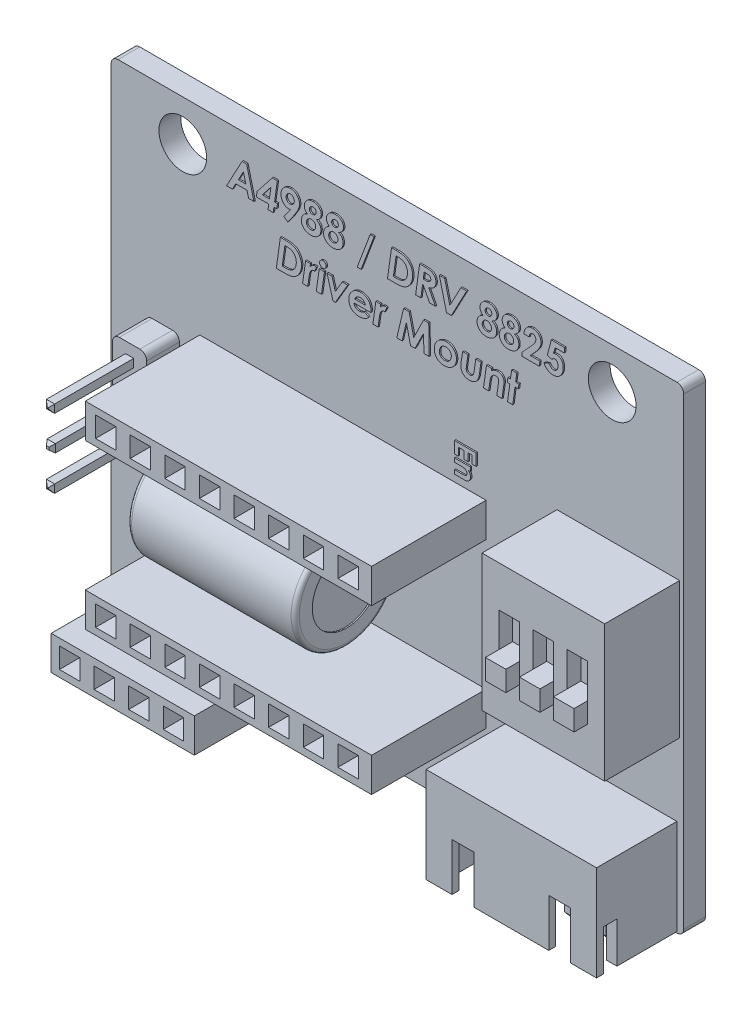
from build123d import *
from OCP.BRepFilletAPI import BRepFilletAPI_MakeChamfer

# Parameters (mm, degrees)
SKETCH1_W                  = 42
SKETCH1_H                  = 35
BOSS_EXTRUDE1_DEPTH        = 1.6
SKETCH2_R                  = 1.75
CUT_EXTRUDE1_DEPTH         = 1.6
SKETCH3_W                  = 9
SKETCH3_H                  = 10
BOSS_EXTRUDE2_DEPTH        = 5.5
SKETCH4_W                  = 1.5
SKETCH4_H                  = 4
CUT_EXTRUDE3_DEPTH         = 1
BOSS_EXTRUDE3_DEPTH        = 1
BOSS_EXTRUDE3_DEPTH_BACK   = 1
SKETCH5_W                  = 1.5
SKETCH5_H                  = 1.489900845
BOSS_EXTRUDE3_2_DEPTH      = 1
BOSS_EXTRUDE3_2_DEPTH_BACK = 1
BOSS_EXTRUDE3_3_DEPTH      = 1
BOSS_EXTRUDE3_3_DEPTH_BACK = 1
SKETCH6_W                  = 10.5
SKETCH6_H                  = 2.5
BOSS_EXTRUDE4_DEPTH        = 8.4
SKETCH7_W                  = 1.5
SKETCH7_H                  = 1.5
CUT_EXTRUDE4_DEPTH         = 8.4
SKETCH8_W                  = 21
SKETCH8_H                  = 2.5
BOSS_EXTRUDE5_DEPTH        = 8.4
SKETCH9_W                  = 1.5
SKETCH9_H                  = 1.5
CUT_EXTRUDE5_DEPTH         = 8.4
SKETCH10_W                 = 2.5
SKETCH10_H                 = 7.3
BOSS_EXTRUDE6_DEPTH        = 2.4
SKETCH11_W                 = 0.6
SKETCH11_H                 = 0.6
BOSS_EXTRUDE7_DEPTH        = 6
SKETCH12_W                 = 12.5
SKETCH12_H                 = 7
BOSS_EXTRUDE9_DEPTH        = 5.9
SKETCH13_W                 = 11
SKETCH13_H                 = 4.869725998
CUT_EXTRUDE6_DEPTH         = 5.9
SKETCH14_W                 = 12.5
SKETCH14_H                 = 1
CUT_EXTRUDE7_DEPTH         = 3
SKETCH15_W                 = 1.6
SKETCH15_H                 = 3.5
CUT_EXTRUDE8_DEPTH         = 3
SKETCH16_R                 = 3.75
BOSS_EXTRUDE10_DEPTH       = 12.3
SKETCH17_R                 = 2.5
CUT_EXTRUDE9_DEPTH         = 0.1
SKETCH18_R                 = 2.5
CUT_EXTRUDE10_DEPTH        = 0.1
FILLET1_R                  = 0.3
FILLET2_R                  = 0.5
SKETCH19_W                 = 0.5
SKETCH19_H                 = 0.5
BOSS_EXTRUDE11_DEPTH       = 6
CHAMFER2_SIZE              = 0.2
CHAMFER2_SIZE2             = 0.246979431
FILLET3_R                  = 0.5
CHAMFER3_SIZE              = 0.2
CHAMFER3_SIZE2             = 0.246979431
BOSS_EXTRUDE12_DEPTH       = 0.1
BOSS_EXTRUDE13_DEPTH       = 0.1


with BuildPart() as part:
    # Sketch1 → Boss-Extrude1 (new body)
    with BuildSketch(Plane.XY):
        Rectangle(SKETCH1_W, SKETCH1_H)
    extrude(amount=BOSS_EXTRUDE1_DEPTH)

    # Sketch2 → Cut-Extrude1 (cut)
    with BuildSketch(Plane.XY.offset(1.6)):
        with Locations((-15.75, 14.5)):
            Circle(SKETCH2_R)
        with Locations((15.75, 14.5)):
            Circle(SKETCH2_R)
    extrude(amount=-CUT_EXTRUDE1_DEPTH, mode=Mode.SUBTRACT)

    # Sketch3 → Boss-Extrude2 (add)
    with BuildSketch(Plane.XY.offset(1.6)):
        with Locations((16.2, 0)):
            Rectangle(SKETCH3_W, SKETCH3_H)
    extrude(amount=BOSS_EXTRUDE2_DEPTH)

    # Sketch4 → Cut-Extrude3 (cut)
    with BuildSketch(Plane.XY.offset(7.1)):
        with Locations((16.2, 0)):
            Rectangle(SKETCH4_W, SKETCH4_H)
        with Locations((18.7, 0)):
            Rectangle(SKETCH4_W, SKETCH4_H)
        with Locations((13.7, 0)):
            Rectangle(SKETCH4_W, SKETCH4_H)
    extrude(amount=-CUT_EXTRUDE3_DEPTH, mode=Mode.SUBTRACT)

    # Sketch6 → Boss-Extrude4 (add)
    with BuildSketch(Plane.XY.offset(1.6)):
        with Locations((-11.75, -14.25)):
            Rectangle(SKETCH6_W, SKETCH6_H)
    extrude(amount=BOSS_EXTRUDE4_DEPTH)

    # Sketch7 → Cut-Extrude4 (cut)
    with BuildSketch(Plane.XY.offset(10)):
        with Locations((-15.65, -14.25)):
            Rectangle(SKETCH7_W, SKETCH7_H)
        with Locations((-13.11, -14.25)):
            Rectangle(SKETCH7_W, SKETCH7_H)
        with Locations((-10.57, -14.25)):
            Rectangle(SKETCH7_W, SKETCH7_H)
        with Locations((-8.03, -14.25)):
            Rectangle(SKETCH7_W, SKETCH7_H)
    extrude(amount=-CUT_EXTRUDE4_DEPTH, mode=Mode.SUBTRACT)

    # Sketch8 → Boss-Extrude5 (add)
    with BuildSketch(Plane.XY.offset(1.6)):
        with Locations((-4, 1.75)):
            Rectangle(SKETCH8_W, SKETCH8_H)
        with Locations((-4, -10.25)):
            Rectangle(SKETCH8_W, SKETCH8_H)
    extrude(amount=BOSS_EXTRUDE5_DEPTH)

    # Sketch9 → Cut-Extrude5 (cut)
    with BuildSketch(Plane.XY.offset(10)):
        with Locations((-13, 1.75)):
            Rectangle(SKETCH9_W, SKETCH9_H)
        with Locations((-13, -10.25)):
            Rectangle(SKETCH9_W, SKETCH9_H)
        with Locations((-10.46, 1.75)):
            Rectangle(SKETCH9_W, SKETCH9_H)
        with Locations((-10.46, -10.25)):
            Rectangle(SKETCH9_W, SKETCH9_H)
        with Locations((-7.92, 1.75)):
            Rectangle(SKETCH9_W, SKETCH9_H)
        with Locations((-7.92, -10.25)):
            Rectangle(SKETCH9_W, SKETCH9_H)
        with Locations((-5.38, 1.75)):
            Rectangle(SKETCH9_W, SKETCH9_H)
        with Locations((-5.38, -10.25)):
            Rectangle(SKETCH9_W, SKETCH9_H)
        with Locations((-2.84, 1.75)):
            Rectangle(SKETCH9_W, SKETCH9_H)
        with Locations((-2.84, -10.25)):
            Rectangle(SKETCH9_W, SKETCH9_H)
        with Locations((-0.3, 1.75)):
            Rectangle(SKETCH9_W, SKETCH9_H)
        with Locations((-0.3, -10.25)):
            Rectangle(SKETCH9_W, SKETCH9_H)
        with Locations((2.24, 1.75)):
            Rectangle(SKETCH9_W, SKETCH9_H)
        with Locations((2.24, -10.25)):
            Rectangle(SKETCH9_W, SKETCH9_H)
        with Locations((4.78, 1.75)):
            Rectangle(SKETCH9_W, SKETCH9_H)
        with Locations((4.78, -10.25)):
            Rectangle(SKETCH9_W, SKETCH9_H)
    extrude(amount=-CUT_EXTRUDE5_DEPTH, mode=Mode.SUBTRACT)

    # Sketch10 → Boss-Extrude6 (add)
    with BuildSketch(Plane.XY.offset(1.6)):
        with Locations((-17.25, -1.35)):
            Rectangle(SKETCH10_W, SKETCH10_H)
    extrude(amount=BOSS_EXTRUDE6_DEPTH)

    # Sketch11 → Boss-Extrude7 (add)
    with BuildSketch(Plane.XY.offset(4)):
        with Locations((-17.25, -1.35)):
            Rectangle(SKETCH11_W, SKETCH11_H)
        with Locations((-17.25, -3.89)):
            Rectangle(SKETCH11_W, SKETCH11_H)
        with Locations((-17.25, 1.19)):
            Rectangle(SKETCH11_W, SKETCH11_H)
    extrude(amount=BOSS_EXTRUDE7_DEPTH)

    # Sketch12 → Boss-Extrude9 (add)
    with BuildSketch(Plane.XY.offset(1.6)):
        with Locations((14.25, -13.9)):
            Rectangle(SKETCH12_W, SKETCH12_H)
    extrude(amount=BOSS_EXTRUDE9_DEPTH)

    # Sketch13 → Cut-Extrude6 (cut)
    with BuildSketch(Plane.XZ.offset(17.4)):
        with Locations((14.25, 4.565137001)):
            Rectangle(SKETCH13_W, SKETCH13_H)
    extrude(amount=-CUT_EXTRUDE6_DEPTH, mode=Mode.SUBTRACT)

    # Sketch14 → Cut-Extrude7 (cut)
    with BuildSketch(Plane.XZ.offset(17.4)):
        with Locations((14.25, 6.5)):
            Rectangle(SKETCH14_W, SKETCH14_H)
    extrude(amount=-CUT_EXTRUDE7_DEPTH, mode=Mode.SUBTRACT)

    # Sketch15 → Cut-Extrude8 (cut)
    with BuildSketch(Plane.XY.offset(7.5)):
        with Locations((10.7, -15.65)):
            Rectangle(SKETCH15_W, SKETCH15_H)
        with Locations((17.8, -15.65)):
            Rectangle(SKETCH15_W, SKETCH15_H)
    extrude(amount=-CUT_EXTRUDE8_DEPTH, mode=Mode.SUBTRACT)

    # Fillet2
    fillet2_edges = [part.edges().sort_by_distance(p)[0] for p in [
        (21, -17.5, 0.8),
        (21, 17.5, 0.8),
        (-21, 17.5, 0.8),
        (-21, -17.5, 0.8),
    ]]
    fillet(fillet2_edges, radius=FILLET2_R)

    # Sketch19 → Boss-Extrude11 (add)
    with BuildSketch(Plane.XZ.offset(11.5)):
        with Locations((10.44, 4.380274002)):
            Rectangle(SKETCH19_W, SKETCH19_H)
        with Locations((12.98, 4.380274002)):
            Rectangle(SKETCH19_W, SKETCH19_H)
        with Locations((15.52, 4.380274002)):
            Rectangle(SKETCH19_W, SKETCH19_H)
        with Locations((18.06, 4.380274002)):
            Rectangle(SKETCH19_W, SKETCH19_H)
    extrude(amount=BOSS_EXTRUDE11_DEPTH)

    # Chamfer2: one chamfer whose edges measure the first distance from different faces: ONE call of the kernel's chamfer builder (chamfer() names one face for all edges)
    chamfer2_edges_1 = [part.edges().sort_by_distance(p)[0] for p in [
        (15.52, -17.5, 4.630274002),
        (15.77, -17.5, 4.380274002),
        (15.52, -17.5, 4.130274002),
        (15.27, -17.5, 4.380274002),
    ]]
    chamfer2_side_1 = [part.faces().sort_by_distance(p)[0] for p in [
        (15.52, -17.5, 4.380274002),
    ]]
    chamfer2_edges_2 = [part.edges().sort_by_distance(p)[0] for p in [
        (18.06, -17.5, 4.630274002),
        (18.31, -17.5, 4.380274002),
        (18.06, -17.5, 4.130274002),
        (17.81, -17.5, 4.380274002),
    ]]
    chamfer2_side_2 = [part.faces().sort_by_distance(p)[0] for p in [
        (18.06, -17.5, 4.380274002),
    ]]
    chamfer2_edges_3 = [part.edges().sort_by_distance(p)[0] for p in [
        (12.98, -17.5, 4.130274002),
        (13.23, -17.5, 4.380274002),
        (12.98, -17.5, 4.630274002),
        (12.73, -17.5, 4.380274002),
    ]]
    chamfer2_side_3 = [part.faces().sort_by_distance(p)[0] for p in [
        (12.98, -17.5, 4.380274002),
    ]]
    chamfer2_edges_4 = [part.edges().sort_by_distance(p)[0] for p in [
        (10.69, -17.5, 4.380274002),
        (10.44, -17.5, 4.130274002),
        (10.19, -17.5, 4.380274002),
        (10.44, -17.5, 4.630274002),
    ]]
    chamfer2_side_4 = [part.faces().sort_by_distance(p)[0] for p in [
        (10.44, -17.5, 4.380274002),
    ]]
    chamfer2 = BRepFilletAPI_MakeChamfer(part.part.solid().wrapped)
    for e in chamfer2_edges_1:
        chamfer2.Add(CHAMFER2_SIZE, CHAMFER2_SIZE2, e.wrapped, chamfer2_side_1[0].wrapped)  # the first distance lies on this face
    for e in chamfer2_edges_2:
        chamfer2.Add(CHAMFER2_SIZE, CHAMFER2_SIZE2, e.wrapped, chamfer2_side_2[0].wrapped)  # the first distance lies on this face
    for e in chamfer2_edges_3:
        chamfer2.Add(CHAMFER2_SIZE, CHAMFER2_SIZE2, e.wrapped, chamfer2_side_3[0].wrapped)  # the first distance lies on this face
    for e in chamfer2_edges_4:
        chamfer2.Add(CHAMFER2_SIZE, CHAMFER2_SIZE2, e.wrapped, chamfer2_side_4[0].wrapped)  # the first distance lies on this face
    add(Compound.cast(chamfer2.Shape()), mode=Mode.REPLACE)

    # Fillet3
    fillet3_edges = [part.edges().sort_by_distance(p)[0] for p in [
        (-16, 2.3, 2.8),
        (-18.5, 2.3, 2.8),
        (-16, -5, 2.8),
        (-18.5, -5, 2.8),
    ]]
    fillet(fillet3_edges, radius=FILLET3_R)

    # Chamfer3: one chamfer whose edges measure the first distance from different faces: ONE call of the kernel's chamfer builder (chamfer() names one face for all edges)
    chamfer3_edges_1 = [part.edges().sort_by_distance(p)[0] for p in [
        (-17.25, -3.59, 10),
    ]]
    chamfer3_side_1 = [part.faces().sort_by_distance(p)[0] for p in [
        (-17.25, -3.59, 7),
    ]]
    chamfer3_edges_2 = [part.edges().sort_by_distance(p)[0] for p in [
        (-16.95, -3.89, 10),
    ]]
    chamfer3_side_2 = [part.faces().sort_by_distance(p)[0] for p in [
        (-16.95, -3.89, 7),
    ]]
    chamfer3_edges_3 = [part.edges().sort_by_distance(p)[0] for p in [
        (-17.25, -4.19, 10),
    ]]
    chamfer3_side_3 = [part.faces().sort_by_distance(p)[0] for p in [
        (-17.25, -4.19, 7),
    ]]
    chamfer3_edges_4 = [part.edges().sort_by_distance(p)[0] for p in [
        (-17.55, -3.89, 10),
    ]]
    chamfer3_side_4 = [part.faces().sort_by_distance(p)[0] for p in [
        (-17.55, -3.89, 7),
    ]]
    chamfer3_edges_5 = [part.edges().sort_by_distance(p)[0] for p in [
        (-17.25, -1.65, 10),
        (-17.55, -1.35, 10),
        (-17.25, -1.05, 10),
        (-16.95, -1.35, 10),
    ]]
    chamfer3_side_5 = [part.faces().sort_by_distance(p)[0] for p in [
        (-17.25, -1.35, 10),
    ]]
    chamfer3_edges_6 = [part.edges().sort_by_distance(p)[0] for p in [
        (-17.25, 1.49, 10),
    ]]
    chamfer3_side_6 = [part.faces().sort_by_distance(p)[0] for p in [
        (-17.25, 1.49, 7),
    ]]
    chamfer3_edges_7 = [part.edges().sort_by_distance(p)[0] for p in [
        (-16.95, 1.19, 10),
    ]]
    chamfer3_side_7 = [part.faces().sort_by_distance(p)[0] for p in [
        (-16.95, 1.19, 7),
    ]]
    chamfer3_edges_8 = [part.edges().sort_by_distance(p)[0] for p in [
        (-17.25, 0.89, 10),
    ]]
    chamfer3_side_8 = [part.faces().sort_by_distance(p)[0] for p in [
        (-17.25, 0.89, 7),
    ]]
    chamfer3_edges_9 = [part.edges().sort_by_distance(p)[0] for p in [
        (-17.55, 1.19, 10),
    ]]
    chamfer3_side_9 = [part.faces().sort_by_distance(p)[0] for p in [
        (-17.55, 1.19, 7),
    ]]
    chamfer3 = BRepFilletAPI_MakeChamfer(part.part.solid().wrapped)
    for e in chamfer3_edges_1:
        chamfer3.Add(CHAMFER3_SIZE, CHAMFER3_SIZE2, e.wrapped, chamfer3_side_1[0].wrapped)  # the first distance lies on this face
    for e in chamfer3_edges_2:
        chamfer3.Add(CHAMFER3_SIZE, CHAMFER3_SIZE2, e.wrapped, chamfer3_side_2[0].wrapped)  # the first distance lies on this face
    for e in chamfer3_edges_3:
        chamfer3.Add(CHAMFER3_SIZE, CHAMFER3_SIZE2, e.wrapped, chamfer3_side_3[0].wrapped)  # the first distance lies on this face
    for e in chamfer3_edges_4:
        chamfer3.Add(CHAMFER3_SIZE, CHAMFER3_SIZE2, e.wrapped, chamfer3_side_4[0].wrapped)  # the first distance lies on this face
    for e in chamfer3_edges_5:
        chamfer3.Add(CHAMFER3_SIZE, CHAMFER3_SIZE2, e.wrapped, chamfer3_side_5[0].wrapped)  # the first distance lies on this face
    for e in chamfer3_edges_6:
        chamfer3.Add(CHAMFER3_SIZE, CHAMFER3_SIZE2, e.wrapped, chamfer3_side_6[0].wrapped)  # the first distance lies on this face
    for e in chamfer3_edges_7:
        chamfer3.Add(CHAMFER3_SIZE, CHAMFER3_SIZE2, e.wrapped, chamfer3_side_7[0].wrapped)  # the first distance lies on this face
    for e in chamfer3_edges_8:
        chamfer3.Add(CHAMFER3_SIZE, CHAMFER3_SIZE2, e.wrapped, chamfer3_side_8[0].wrapped)  # the first distance lies on this face
    for e in chamfer3_edges_9:
        chamfer3.Add(CHAMFER3_SIZE, CHAMFER3_SIZE2, e.wrapped, chamfer3_side_9[0].wrapped)  # the first distance lies on this face
    add(Compound.cast(chamfer3.Shape()), mode=Mode.REPLACE)

    # Sketch20 → Boss-Extrude12 (add)
    # profile 1 of 25: a face of its own
    with BuildSketch(Plane.XY.offset(1.6)):
        Polygon((-11.298108491, 15.681485792), (-10.964835254, 15.681485792), (-10.427612364, 13.564819126), (-10.818551199, 13.564819126), (-10.935578443, 14.026143912), (-11.760705312, 14.026143912), (-12.008328176, 13.564819126), (-12.435732022, 13.564819126), align=None)
        Polygon((-11.025892946, 14.37892169), (-11.200585788, 15.067940787), (-11.570748048, 14.37892169), align=None, mode=Mode.SUBTRACT)
    # profile 2 of 25: a face of its own
    with BuildSketch(Plane.XY.offset(1.6)):
        Polygon((-9.082647086, 15.735759297), (-8.714180873, 15.735759297), (-8.912618373, 14.297511433), (-8.705276627, 14.297511433), (-8.751069896, 13.944733656), (-8.960955713, 13.944733656), (-9.01353317, 13.564819126), (-9.396415783, 13.564819126), (-9.343838325, 13.944733656), (-10.237655099, 13.944733656), (-10.210518347, 14.311927833), align=None)
        Polygon((-9.186105953, 15.09041341), (-9.814067358, 14.297511433), (-9.295500986, 14.297511433), align=None, mode=Mode.SUBTRACT)
    # profile 3 of 25: a face of its own
    with BuildSketch(Plane.XY.offset(1.6)):
        with BuildLine():
            Line((-7.939511402, 13.510545622), (-8.233351546, 13.707287074))
            Line((-8.233351546, 13.707287074), (-7.744465996, 14.39842623))
            add(Edge.make_bspline(
                [(-7.744465996, 14.39842623), (-7.767819123, 14.392854922), (-7.81177397, 14.382368703), (-7.85688573, 14.380021723), (-7.878029698, 14.37892169)],
                knots=[0, 0, 0, 0, 1.062596194, 2, 2, 2, 2], degree=3))
            add(Edge.make_bspline(
                [(-7.878029698, 14.37892169), (-7.89728101, 14.37951551), (-7.935265933, 14.380687182), (-7.991189209, 14.389291428), (-8.044865828, 14.403849363), (-8.09657851, 14.423803452), (-8.146051242, 14.449896177), (-8.193224141, 14.48195439), (-8.238285367, 14.51952597), (-8.280973448, 14.56203654), (-8.319472346, 14.60923019), (-8.353866193, 14.659350525), (-8.382074192, 14.712794118), (-8.406116681, 14.768358612), (-8.424489002, 14.826900099), (-8.436832343, 14.88832491), (-8.445379206, 14.952371016), (-8.446208308, 14.996112501), (-8.446629458, 15.018331412)],
                knots=[0, 0, 0, 0, 0.969934056, 1.913784993, 2.843311147, 3.767857612, 4.701332088, 5.655473226, 6.636716954, 7.654054707, 8.686390878, 9.701782049, 10.711913777, 11.726630261, 12.749339213, 13.796991767, 14.880960657, 16, 16, 16, 16], degree=3))
            add(Edge.make_bspline(
                [(-8.446629458, 15.018331412), (-8.446108709, 15.043377401), (-8.445084029, 15.092660509), (-8.43551454, 15.165073393), (-8.419832446, 15.234313757), (-8.398291321, 15.300482336), (-8.370069364, 15.363038521), (-8.335944797, 15.422482048), (-8.295360017, 15.478658504), (-8.249124044, 15.531258996), (-8.197892896, 15.578985485), (-8.143219102, 15.621312185), (-8.084571018, 15.656783447), (-8.022510079, 15.685561991), (-7.957049242, 15.708271178), (-7.888285295, 15.724314411), (-7.815959012, 15.733701829), (-7.766683611, 15.735063379), (-7.741497914, 15.735759297)],
                knots=[0, 0, 0, 0, 1.067153374, 2.099842657, 3.106801845, 4.089832761, 5.060584944, 6.026765153, 7.006523203, 8.009636506, 9.007035051, 9.986663441, 10.951659663, 11.921944397, 12.897414564, 13.899858298, 14.926573288, 16, 16, 16, 16], degree=3))
            add(Edge.make_bspline(
                [(-7.741497914, 15.735759297), (-7.718564604, 15.735260047), (-7.67348967, 15.734278783), (-7.607669677, 15.724459091), (-7.544636554, 15.709836957), (-7.484593623, 15.688552508), (-7.427545936, 15.660773196), (-7.373407878, 15.627091782), (-7.322313965, 15.587393171), (-7.274659625, 15.542176581), (-7.231391804, 15.492607196), (-7.193364239, 15.439849852), (-7.161421705, 15.384243732), (-7.13471806, 15.326066105), (-7.115242452, 15.264534025), (-7.099964331, 15.200860407), (-7.091576113, 15.134168824), (-7.090393829, 15.08888014), (-7.089791851, 15.065820728)],
                knots=[0, 0, 0, 0, 1.054208263, 2.072023952, 3.054444288, 4.027070767, 4.995341725, 5.967729158, 6.954763786, 7.966519073, 8.984832979, 9.977163491, 10.952913907, 11.930568481, 12.915373779, 13.916778088, 14.939296369, 16, 16, 16, 16], degree=3))
            add(Edge.make_bspline(
                [(-7.089791851, 15.065820728), (-7.090084787, 15.047150458), (-7.090667525, 15.010009572), (-7.096356993, 14.954889841), (-7.105662784, 14.900642721), (-7.114579447, 14.865212852), (-7.119048662, 14.847454676)],
                knots=[0, 0, 0, 0, 1.013662365, 2.016484985, 3.005821674, 4, 4, 4, 4], degree=3))
            add(Edge.make_bspline(
                [(-7.119048662, 14.847454676), (-7.126789653, 14.822329301), (-7.142253705, 14.772136747), (-7.17108836, 14.69885676), (-7.203061247, 14.626956322), (-7.227608369, 14.580618553), (-7.239892011, 14.557430638)],
                knots=[0, 0, 0, 0, 1.00191864, 2.001516544, 2.999937518, 4, 4, 4, 4], degree=3))
            add(Edge.make_bspline(
                [(-7.239892011, 14.557430638), (-7.261557662, 14.518141668), (-7.304129926, 14.440940185), (-7.371215044, 14.329163894), (-7.438464579, 14.222375418), (-7.48558241, 14.154179916), (-7.508715462, 14.120698533)],
                knots=[0, 0, 0, 0, 1.049210121, 2.061662041, 3.048350216, 4, 4, 4, 4], degree=3))
            Line((-7.508715462, 14.120698533), (-7.939511402, 13.510545622))
        make_face()
        with BuildLine():
            add(Edge.make_bspline(
                [(-7.781355019, 14.731699468), (-7.770877267, 14.7320473), (-7.750101691, 14.732736991), (-7.719573334, 14.737571977), (-7.690011361, 14.744989069), (-7.662015075, 14.756488322), (-7.634415741, 14.769701971), (-7.608873655, 14.787509358), (-7.583836945, 14.807390465), (-7.560936783, 14.830784161), (-7.539392881, 14.85579845), (-7.520661772, 14.882654627), (-7.504835904, 14.910750323), (-7.492166289, 14.940246119), (-7.481907532, 14.970699599), (-7.474640059, 15.00250135), (-7.470342497, 15.035454117), (-7.469919679, 15.057893095), (-7.469706381, 15.069212822)],
                knots=[0, 0, 0, 0, 0.985080672, 1.953245337, 2.901122396, 3.844046743, 4.795180322, 5.772156162, 6.764474587, 7.798388123, 8.845124698, 9.866573221, 10.872333035, 11.872455336, 12.881284841, 13.890552111, 14.935852891, 16, 16, 16, 16], degree=3))
            add(Edge.make_bspline(
                [(-7.469706381, 15.069212822), (-7.470591775, 15.090515717), (-7.472317814, 15.132044866), (-7.488503328, 15.19160583), (-7.515299849, 15.245747507), (-7.546127804, 15.285532659), (-7.574821058, 15.313572756), (-7.597464516, 15.332353508), (-7.621865287, 15.347737784), (-7.646913044, 15.361034217), (-7.673804671, 15.370776258), (-7.701611646, 15.377974496), (-7.730757667, 15.382377593), (-7.75052825, 15.382777984), (-7.760578443, 15.382981519)],
                knots=[0, 0, 0, 0, 1.60545481, 3.129770537, 4.618423052, 6.139935935, 6.901925764, 7.64508505, 8.355351643, 9.075880782, 9.781403904, 10.508537769, 11.241828942, 12, 12, 12, 12], degree=3))
            add(Edge.make_bspline(
                [(-7.760578443, 15.382981519), (-7.771196586, 15.38263688), (-7.792111788, 15.381958024), (-7.822800373, 15.377144619), (-7.852109309, 15.369606164), (-7.880166658, 15.35884664), (-7.906813876, 15.344754855), (-7.932355717, 15.327835783), (-7.956374513, 15.307483929), (-7.978912856, 15.284468094), (-7.999589303, 15.259268567), (-8.017544852, 15.232243487), (-8.032882803, 15.203909157), (-8.045085378, 15.173983071), (-8.055109994, 15.142860294), (-8.061597648, 15.110125333), (-8.066158894, 15.075983992), (-8.066527027, 15.052692445), (-8.066714928, 15.040804035)],
                knots=[0, 0, 0, 0, 0.995464246, 1.960826493, 2.905959859, 3.828995532, 4.771616354, 5.727377317, 6.696372172, 7.717963959, 8.744701472, 9.748250483, 10.756340463, 11.760589422, 12.775019926, 13.817379281, 14.885952523, 16, 16, 16, 16], degree=3))
            add(Edge.make_bspline(
                [(-8.066714928, 15.040804035), (-8.065816197, 15.019780393), (-8.064065955, 14.978837722), (-8.048104912, 14.920226429), (-8.023017235, 14.866527148), (-7.993110767, 14.82719972), (-7.96501875, 14.799966295), (-7.942963222, 14.781302272), (-7.919097136, 14.766046802), (-7.893953093, 14.753826157), (-7.867740947, 14.74384809), (-7.840185001, 14.736671691), (-7.811176096, 14.732307146), (-7.791405314, 14.731904267), (-7.781355019, 14.731699468)],
                knots=[0, 0, 0, 0, 1.608637365, 3.132754666, 4.62043579, 6.128489542, 6.886920241, 7.617928657, 8.339158067, 9.051380967, 9.757646507, 10.485517361, 11.23012673, 12, 12, 12, 12], degree=3))
        make_face(mode=Mode.SUBTRACT)
    # profile 4 of 25: a face of its own
    with BuildSketch(Plane.XY.offset(1.6)):
        with BuildLine():
            add(Edge.make_bspline(
                [(-5.85549364, 14.699474574), (-5.829947272, 14.688793981), (-5.779834189, 14.667842374), (-5.712384241, 14.623770969), (-5.653242454, 14.571647519), (-5.612403312, 14.520628324), (-5.584044876, 14.476757524), (-5.565729047, 14.441843928), (-5.550643085, 14.405262542), (-5.537656065, 14.367394507), (-5.528087969, 14.327752044), (-5.520820832, 14.286705947), (-5.516469931, 14.244039003), (-5.516065796, 14.215121864), (-5.515860227, 14.200412742)],
                knots=[0, 0, 0, 0, 1.541464985, 3.0238178, 4.469784276, 5.921154489, 6.651437481, 7.38125241, 8.116115087, 8.856410813, 9.611538438, 10.387763072, 11.179912327, 12, 12, 12, 12], degree=3))
            add(Edge.make_bspline(
                [(-5.515860227, 14.200412742), (-5.51601315, 14.184143782), (-5.516315671, 14.151959448), (-5.521505555, 14.104299442), (-5.528200953, 14.057713627), (-5.53919736, 14.012656479), (-5.552187999, 13.96880746), (-5.568370804, 13.926090859), (-5.587915711, 13.884852808), (-5.609878995, 13.844734117), (-5.635003235, 13.806841386), (-5.662068691, 13.770377238), (-5.692363855, 13.73670972), (-5.724620652, 13.704486361), (-5.759929209, 13.675089429), (-5.79738163, 13.647153777), (-5.837689873, 13.6219943), (-5.880046922, 13.598549975), (-5.924397333, 13.577886199), (-5.970473164, 13.560032578), (-6.01805452, 13.544781071), (-6.067276251, 13.531970746), (-6.118133777, 13.52225944), (-6.170539763, 13.515633814), (-6.224305297, 13.511140864), (-6.260698208, 13.510745388), (-6.279081381, 13.510545622)],
                knots=[0, 0, 0, 0, 1.013897126, 2.005758377, 2.986752608, 3.946615008, 4.894629566, 5.837467942, 6.791608008, 7.738392708, 8.686857814, 9.624615693, 10.567330481, 11.508395868, 12.4653405, 13.429562997, 14.419856707, 15.425715908, 16.446941402, 17.468242957, 18.505094008, 19.561096764, 20.637967774, 21.731161366, 22.853940174, 24, 24, 24, 24], degree=3))
            add(Edge.make_bspline(
                [(-6.279081381, 13.510545622), (-6.302988013, 13.511168763), (-6.349807999, 13.512389155), (-6.418537832, 13.520407201), (-6.48395934, 13.534409567), (-6.546293053, 13.553987775), (-6.605516052, 13.579108662), (-6.661674613, 13.609685672), (-6.714559125, 13.645888918), (-6.763306923, 13.687476696), (-6.808192634, 13.732198376), (-6.846774498, 13.780580974), (-6.880292105, 13.83051254), (-6.907045275, 13.883317835), (-6.928557621, 13.938020326), (-6.943221511, 13.995283856), (-6.952469989, 14.054532907), (-6.953557483, 14.094799209), (-6.95410809, 14.11518638)],
                knots=[0, 0, 0, 0, 1.135997289, 2.224795934, 3.282557984, 4.310628835, 5.324785004, 6.334617724, 7.344294097, 8.364171613, 9.375722553, 10.350138575, 11.300131138, 12.228268618, 13.157450381, 14.08760252, 15.031736902, 16, 16, 16, 16], degree=3))
            add(Edge.make_bspline(
                [(-6.95410809, 14.11518638), (-6.953484093, 14.13713718), (-6.952228874, 14.181292912), (-6.94106513, 14.247054423), (-6.923679596, 14.312585869), (-6.89897923, 14.376685381), (-6.869490682, 14.43850103), (-6.834565138, 14.495544026), (-6.795431976, 14.547175805), (-6.751486486, 14.593971178), (-6.701016833, 14.635958191), (-6.643621797, 14.67406889), (-6.578462618, 14.708259584), (-6.531556675, 14.727037007), (-6.507199703, 14.736787609)],
                knots=[0, 0, 0, 0, 0.966358808, 1.943905445, 2.930138045, 3.948911318, 4.965341682, 5.943482994, 6.889898855, 7.81483236, 8.765090803, 9.775304409, 10.844776544, 12, 12, 12, 12], degree=3))
            add(Edge.make_bspline(
                [(-6.507199703, 14.736787609), (-6.522833431, 14.747077563), (-6.553142278, 14.767026525), (-6.593656171, 14.801274255), (-6.628601293, 14.83750108), (-6.647038265, 14.864429605), (-6.656027828, 14.87755951)],
                knots=[0, 0, 0, 0, 1.086599153, 2.106571708, 3.076795543, 4, 4, 4, 4], degree=3))
            add(Edge.make_bspline(
                [(-6.656027828, 14.87755951), (-6.668616889, 14.898980489), (-6.693444221, 14.941225561), (-6.717992709, 15.010213747), (-6.734247371, 15.08131233), (-6.73608549, 15.129895763), (-6.737014073, 15.154439185)],
                knots=[0, 0, 0, 0, 1.01806741, 2.007766889, 2.993561943, 4, 4, 4, 4], degree=3))
            add(Edge.make_bspline(
                [(-6.737014073, 15.154439185), (-6.736075359, 15.179258872), (-6.734195128, 15.228972349), (-6.717675842, 15.302112004), (-6.692000012, 15.373603802), (-6.655940373, 15.442360201), (-6.610617494, 15.507072991), (-6.555408757, 15.564943597), (-6.491827065, 15.615886059), (-6.419632103, 15.658007119), (-6.342085747, 15.693092418), (-6.259865598, 15.717317334), (-6.174515593, 15.732907316), (-6.116471175, 15.73479897), (-6.087004057, 15.735759297)],
                knots=[0, 0, 0, 0, 0.920470165, 1.843688453, 2.76992918, 3.734585969, 4.717327891, 5.693547554, 6.694185358, 7.731825961, 8.788908859, 9.846421484, 10.906703612, 12, 12, 12, 12], degree=3))
            add(Edge.make_bspline(
                [(-6.087004057, 15.735759297), (-6.065642652, 15.735246809), (-6.023644428, 15.734239216), (-5.962183864, 15.727031798), (-5.903656926, 15.714817091), (-5.848268149, 15.697154119), (-5.795465171, 15.675418062), (-5.746042372, 15.647746168), (-5.699086933, 15.616168034), (-5.656211561, 15.579116288), (-5.617206538, 15.539394814), (-5.582800003, 15.497514175), (-5.553790891, 15.453618307), (-5.530006464, 15.407874115), (-5.511516873, 15.360232879), (-5.498501697, 15.310882214), (-5.49002465, 15.259744425), (-5.489160308, 15.225000196), (-5.488723475, 15.207440654)],
                knots=[0, 0, 0, 0, 1.153096654, 2.26707992, 3.335605646, 4.375719133, 5.401714499, 6.412617512, 7.428490256, 8.451445124, 9.465855333, 10.431151224, 11.372908333, 12.301184165, 13.209487923, 14.12567389, 15.05272585, 16, 16, 16, 16], degree=3))
            add(Edge.make_bspline(
                [(-5.488723475, 15.207440654), (-5.489720972, 15.181339499), (-5.491694496, 15.129699014), (-5.509396995, 15.054135787), (-5.538170369, 14.981994709), (-5.571474387, 14.925347443), (-5.603280493, 14.8821373), (-5.630562452, 14.85112231), (-5.660761925, 14.821778191), (-5.694080815, 14.794200722), (-5.730042234, 14.767996451), (-5.768874174, 14.743158974), (-5.810954949, 14.720366383), (-5.840440046, 14.706535779), (-5.85549364, 14.699474574)],
                knots=[0, 0, 0, 0, 1.410602094, 2.790841224, 4.173979642, 5.599674553, 6.332295756, 7.074709729, 7.831826395, 8.608276812, 9.412839061, 10.238069433, 11.10044768, 12, 12, 12, 12], degree=3))
        make_face()
        with BuildLine():
            add(Edge.make_bspline(
                [(-6.086580045, 15.382981519), (-6.105207849, 15.38220747), (-6.141372499, 15.380704706), (-6.193016455, 15.365414682), (-6.240207461, 15.341636165), (-6.28073307, 15.307821489), (-6.314954309, 15.26862167), (-6.33899246, 15.223599174), (-6.354828316, 15.174996921), (-6.356333718, 15.140854968), (-6.357099543, 15.123486327)],
                knots=[0, 0, 0, 0, 1.068429257, 2.074284832, 3.070241312, 4.086972024, 5.090164471, 6.043007022, 7.004441531, 8, 8, 8, 8], degree=3))
            add(Edge.make_bspline(
                [(-6.357099543, 15.123486327), (-6.356435479, 15.107438179), (-6.355153305, 15.076452479), (-6.343289997, 15.032232452), (-6.324048376, 14.992493143), (-6.29716981, 14.957960786), (-6.263922711, 14.929871051), (-6.225404501, 14.908845745), (-6.181400047, 14.896923723), (-6.150535845, 14.89534208), (-6.134493373, 14.89451998)],
                knots=[0, 0, 0, 0, 1.072640992, 2.07105101, 3.040153855, 4.011148896, 4.977985479, 5.93481482, 6.926566298, 8, 8, 8, 8], degree=3))
            add(Edge.make_bspline(
                [(-6.134493373, 14.89451998), (-6.116591358, 14.895370161), (-6.081619108, 14.897031019), (-6.031268672, 14.911477469), (-5.985669847, 14.935832012), (-5.945094014, 14.968441895), (-5.911180945, 15.007836315), (-5.886752858, 15.052833888), (-5.870835529, 15.101937906), (-5.86938286, 15.136363479), (-5.868638005, 15.154015173)],
                knots=[0, 0, 0, 0, 1.037945009, 2.027664072, 3.011479609, 4.021405977, 5.034361915, 6.007613099, 6.978404693, 8, 8, 8, 8], degree=3))
            add(Edge.make_bspline(
                [(-5.868638005, 15.154015173), (-5.869350588, 15.170754086), (-5.870720355, 15.202930538), (-5.881685969, 15.248550319), (-5.900636376, 15.288662152), (-5.927180034, 15.322393877), (-5.959831909, 15.34934906), (-5.997473474, 15.369444442), (-6.040541691, 15.381014502), (-6.070821272, 15.382308216), (-6.086580045, 15.382981519)],
                knots=[0, 0, 0, 0, 1.125735341, 2.163949832, 3.13403846, 4.089322881, 5.028366283, 5.964514375, 6.940647228, 8, 8, 8, 8], degree=3))
        make_face(mode=Mode.SUBTRACT)
        with BuildLine():
            add(Edge.make_bspline(
                [(-6.205303336, 14.541742203), (-6.217900682, 14.541432348), (-6.242636253, 14.540823933), (-6.27899223, 14.535540877), (-6.313818308, 14.527147402), (-6.347407937, 14.515138375), (-6.379374578, 14.499375642), (-6.410382361, 14.480635655), (-6.439444454, 14.45805871), (-6.466909768, 14.432627227), (-6.492301906, 14.405128555), (-6.513905805, 14.375000734), (-6.532895091, 14.343754103), (-6.547566155, 14.310250329), (-6.559640943, 14.275427151), (-6.568026742, 14.238752688), (-6.573268298, 14.200423722), (-6.573881504, 14.174282669), (-6.57419356, 14.160979649)],
                knots=[0, 0, 0, 0, 1.022699828, 2.008126405, 2.97703308, 3.928371719, 4.898705406, 5.867340031, 6.866115651, 7.881574119, 8.905497311, 9.899710627, 10.88800813, 11.869414728, 12.86409184, 13.877666882, 14.919957873, 16, 16, 16, 16], degree=3))
            add(Edge.make_bspline(
                [(-6.57419356, 14.160979649), (-6.573986537, 14.150647858), (-6.573579151, 14.130316726), (-6.569243229, 14.100454552), (-6.561932524, 14.071964571), (-6.552245113, 14.044588253), (-6.539425389, 14.018556648), (-6.523581549, 13.993976754), (-6.505274363, 13.970415473), (-6.477207443, 13.941415629), (-6.437262656, 13.909968063), (-6.382262062, 13.882917882), (-6.321446699, 13.866321525), (-6.278905878, 13.864341476), (-6.25703277, 13.863323399)],
                knots=[0, 0, 0, 0, 0.765577671, 1.506520972, 2.230828579, 2.943445027, 3.655753251, 4.376641964, 5.10818981, 5.864097246, 7.364868711, 8.850381499, 10.380568448, 12, 12, 12, 12], degree=3))
            add(Edge.make_bspline(
                [(-6.25703277, 13.863323399), (-6.244581907, 13.863680352), (-6.220016864, 13.864384606), (-6.183920109, 13.869024541), (-6.149245818, 13.877112507), (-6.116217943, 13.888650415), (-6.084524856, 13.902989281), (-6.054791575, 13.921147179), (-6.026148115, 13.941828803), (-5.999655642, 13.966072598), (-5.97531408, 13.992393462), (-5.953932528, 14.02047446), (-5.936041261, 14.050089875), (-5.920824885, 14.080992258), (-5.910359152, 14.113874744), (-5.901271892, 14.147552614), (-5.896870581, 14.183054029), (-5.896144799, 14.207188325), (-5.895774757, 14.219493271)],
                knots=[0, 0, 0, 0, 1.056305773, 2.084048128, 3.08168982, 4.071445464, 5.04796526, 6.026838119, 7.02217112, 8.040920205, 9.067752774, 10.060626909, 11.029237137, 11.999997446, 12.974527425, 13.951709593, 14.95567281, 16, 16, 16, 16], degree=3))
            add(Edge.make_bspline(
                [(-5.895774757, 14.219493271), (-5.895929374, 14.230678437), (-5.896232243, 14.252588305), (-5.901262249, 14.284632909), (-5.908554289, 14.315359462), (-5.917827375, 14.34508794), (-5.931603338, 14.372855231), (-5.947134115, 14.399727403), (-5.965796629, 14.425275589), (-5.987594528, 14.448629207), (-6.0103367, 14.470780927), (-6.03530959, 14.489290798), (-6.060742963, 14.505735012), (-6.087649683, 14.518903565), (-6.115663042, 14.529128749), (-6.144698313, 14.536155875), (-6.174594029, 14.541285851), (-6.19496299, 14.541588541), (-6.205303336, 14.541742203)],
                knots=[0, 0, 0, 0, 1.079541345, 2.114640806, 3.124851578, 4.130993379, 5.114360147, 6.112033921, 7.128042352, 8.162330853, 9.195897967, 10.190014293, 11.159824633, 12.118612945, 13.077595717, 14.034729518, 15.002326226, 16, 16, 16, 16], degree=3))
        make_face(mode=Mode.SUBTRACT)
    # profile 5 of 25: a face of its own
    with BuildSketch(Plane.XY.offset(1.6)):
        with BuildLine():
            add(Edge.make_bspline(
                [(-4.227288512, 14.699474574), (-4.201742144, 14.688793981), (-4.15162906, 14.667842374), (-4.084179113, 14.623770969), (-4.025037326, 14.571647519), (-3.984198184, 14.520628324), (-3.955839748, 14.476757524), (-3.937523919, 14.441843928), (-3.922437957, 14.405262542), (-3.909450937, 14.367394507), (-3.89988284, 14.327752044), (-3.892615704, 14.286705947), (-3.888264803, 14.244039003), (-3.887860668, 14.215121864), (-3.887655099, 14.200412742)],
                knots=[0, 0, 0, 0, 1.541464985, 3.0238178, 4.469784276, 5.921154489, 6.651437481, 7.38125241, 8.116115087, 8.856410813, 9.611538438, 10.387763072, 11.179912327, 12, 12, 12, 12], degree=3))
            add(Edge.make_bspline(
                [(-3.887655099, 14.200412742), (-3.887808021, 14.184143782), (-3.888110543, 14.151959448), (-3.893300426, 14.104299442), (-3.899995825, 14.057713627), (-3.910992232, 14.012656479), (-3.923982871, 13.96880746), (-3.940165676, 13.926090859), (-3.959710583, 13.884852808), (-3.981673867, 13.844734117), (-4.006798107, 13.806841386), (-4.033863563, 13.770377238), (-4.064158727, 13.73670972), (-4.096415524, 13.704486361), (-4.131724081, 13.675089429), (-4.169176502, 13.647153777), (-4.209484744, 13.6219943), (-4.251841794, 13.598549975), (-4.296192204, 13.577886199), (-4.342268036, 13.560032578), (-4.389849392, 13.544781071), (-4.439071123, 13.531970746), (-4.489928649, 13.52225944), (-4.542334635, 13.515633814), (-4.596100169, 13.511140864), (-4.63249308, 13.510745388), (-4.650876253, 13.510545622)],
                knots=[0, 0, 0, 0, 1.013897126, 2.005758377, 2.986752608, 3.946615008, 4.894629566, 5.837467942, 6.791608008, 7.738392708, 8.686857814, 9.624615693, 10.567330481, 11.508395868, 12.4653405, 13.429562997, 14.419856707, 15.425715908, 16.446941402, 17.468242957, 18.505094008, 19.561096764, 20.637967774, 21.731161366, 22.853940174, 24, 24, 24, 24], degree=3))
            add(Edge.make_bspline(
                [(-4.650876253, 13.510545622), (-4.674782885, 13.511168763), (-4.721602871, 13.512389155), (-4.790332704, 13.520407201), (-4.855754212, 13.534409567), (-4.918087925, 13.553987775), (-4.977310924, 13.579108662), (-5.033469484, 13.609685672), (-5.086353997, 13.645888918), (-5.135101794, 13.687476696), (-5.179987505, 13.732198376), (-5.21856937, 13.780580974), (-5.252086977, 13.83051254), (-5.278840147, 13.883317835), (-5.300352493, 13.938020326), (-5.315016383, 13.995283856), (-5.32426486, 14.054532907), (-5.325352355, 14.094799209), (-5.325902962, 14.11518638)],
                knots=[0, 0, 0, 0, 1.135997289, 2.224795934, 3.282557984, 4.310628835, 5.324785004, 6.334617724, 7.344294097, 8.364171613, 9.375722553, 10.350138575, 11.300131138, 12.228268618, 13.157450381, 14.08760252, 15.031736902, 16, 16, 16, 16], degree=3))
            add(Edge.make_bspline(
                [(-5.325902962, 14.11518638), (-5.325278965, 14.13713718), (-5.324023746, 14.181292912), (-5.312860001, 14.247054423), (-5.295474467, 14.312585869), (-5.270774102, 14.376685381), (-5.241285554, 14.43850103), (-5.206360009, 14.495544026), (-5.167226848, 14.547175805), (-5.123281358, 14.593971178), (-5.072811705, 14.635958191), (-5.015416669, 14.67406889), (-4.95025749, 14.708259584), (-4.903351546, 14.727037007), (-4.878994575, 14.736787609)],
                knots=[0, 0, 0, 0, 0.966358808, 1.943905445, 2.930138045, 3.948911318, 4.965341682, 5.943482994, 6.889898855, 7.81483236, 8.765090803, 9.775304409, 10.844776544, 12, 12, 12, 12], degree=3))
            add(Edge.make_bspline(
                [(-4.878994575, 14.736787609), (-4.894628302, 14.747077563), (-4.924937149, 14.767026525), (-4.965451042, 14.801274255), (-5.000396165, 14.83750108), (-5.018833137, 14.864429605), (-5.0278227, 14.87755951)],
                knots=[0, 0, 0, 0, 1.086599153, 2.106571708, 3.076795543, 4, 4, 4, 4], degree=3))
            add(Edge.make_bspline(
                [(-5.0278227, 14.87755951), (-5.04041176, 14.898980489), (-5.065239093, 14.941225561), (-5.089787581, 15.010213747), (-5.106042242, 15.08131233), (-5.107880362, 15.129895763), (-5.108808945, 15.154439185)],
                knots=[0, 0, 0, 0, 1.01806741, 2.007766889, 2.993561943, 4, 4, 4, 4], degree=3))
            add(Edge.make_bspline(
                [(-5.108808945, 15.154439185), (-5.107870231, 15.179258872), (-5.10599, 15.228972349), (-5.089470713, 15.302112004), (-5.063794884, 15.373603802), (-5.027735245, 15.442360201), (-4.982412366, 15.507072991), (-4.927203629, 15.564943597), (-4.863621936, 15.615886059), (-4.791426975, 15.658007119), (-4.713880619, 15.693092418), (-4.63166047, 15.717317334), (-4.546310465, 15.732907316), (-4.488266047, 15.73479897), (-4.458798929, 15.735759297)],
                knots=[0, 0, 0, 0, 0.920470165, 1.843688453, 2.76992918, 3.734585969, 4.717327891, 5.693547554, 6.694185358, 7.731825961, 8.788908859, 9.846421484, 10.906703612, 12, 12, 12, 12], degree=3))
            add(Edge.make_bspline(
                [(-4.458798929, 15.735759297), (-4.437437524, 15.735246809), (-4.3954393, 15.734239216), (-4.333978736, 15.727031798), (-4.275451798, 15.714817091), (-4.220063021, 15.697154119), (-4.167260043, 15.675418062), (-4.117837244, 15.647746168), (-4.070881805, 15.616168034), (-4.028006433, 15.579116288), (-3.98900141, 15.539394814), (-3.954594875, 15.497514175), (-3.925585763, 15.453618307), (-3.901801336, 15.407874115), (-3.883311745, 15.360232879), (-3.870296569, 15.310882214), (-3.861819522, 15.259744425), (-3.86095518, 15.225000196), (-3.860518347, 15.207440654)],
                knots=[0, 0, 0, 0, 1.153096654, 2.26707992, 3.335605646, 4.375719133, 5.401714499, 6.412617512, 7.428490256, 8.451445124, 9.465855333, 10.431151224, 11.372908333, 12.301184165, 13.209487923, 14.12567389, 15.05272585, 16, 16, 16, 16], degree=3))
            add(Edge.make_bspline(
                [(-3.860518347, 15.207440654), (-3.861515844, 15.181339499), (-3.863489368, 15.129699014), (-3.881191867, 15.054135787), (-3.909965241, 14.981994709), (-3.943269258, 14.925347443), (-3.975075365, 14.8821373), (-4.002357323, 14.85112231), (-4.032556796, 14.821778191), (-4.065875687, 14.794200722), (-4.101837105, 14.767996451), (-4.140669046, 14.743158974), (-4.182749821, 14.720366383), (-4.212234918, 14.706535779), (-4.227288512, 14.699474574)],
                knots=[0, 0, 0, 0, 1.410602094, 2.790841224, 4.173979642, 5.599674553, 6.332295756, 7.074709729, 7.831826395, 8.608276812, 9.412839061, 10.238069433, 11.10044768, 12, 12, 12, 12], degree=3))
        make_face()
        with BuildLine():
            add(Edge.make_bspline(
                [(-4.458374917, 15.382981519), (-4.477002721, 15.38220747), (-4.513167371, 15.380704706), (-4.564811327, 15.365414682), (-4.612002333, 15.341636165), (-4.652527942, 15.307821489), (-4.686749181, 15.26862167), (-4.710787332, 15.223599174), (-4.726623188, 15.174996921), (-4.72812859, 15.140854968), (-4.728894415, 15.123486327)],
                knots=[0, 0, 0, 0, 1.068429257, 2.074284832, 3.070241312, 4.086972024, 5.090164471, 6.043007022, 7.004441531, 8, 8, 8, 8], degree=3))
            add(Edge.make_bspline(
                [(-4.728894415, 15.123486327), (-4.72823035, 15.107438179), (-4.726948177, 15.076452479), (-4.715084869, 15.032232452), (-4.695843248, 14.992493143), (-4.668964681, 14.957960786), (-4.635717583, 14.929871051), (-4.597199373, 14.908845745), (-4.553194919, 14.896923723), (-4.522330717, 14.89534208), (-4.506288245, 14.89451998)],
                knots=[0, 0, 0, 0, 1.072640992, 2.07105101, 3.040153855, 4.011148896, 4.977985479, 5.93481482, 6.926566298, 8, 8, 8, 8], degree=3))
            add(Edge.make_bspline(
                [(-4.506288245, 14.89451998), (-4.48838623, 14.895370161), (-4.45341398, 14.897031019), (-4.403063543, 14.911477469), (-4.357464719, 14.935832012), (-4.316888886, 14.968441895), (-4.282975817, 15.007836315), (-4.25854773, 15.052833888), (-4.242630401, 15.101937906), (-4.241177732, 15.136363479), (-4.240432877, 15.154015173)],
                knots=[0, 0, 0, 0, 1.037945009, 2.027664072, 3.011479609, 4.021405977, 5.034361915, 6.007613099, 6.978404693, 8, 8, 8, 8], degree=3))
            add(Edge.make_bspline(
                [(-4.240432877, 15.154015173), (-4.24114546, 15.170754086), (-4.242515227, 15.202930538), (-4.253480841, 15.248550319), (-4.272431248, 15.288662152), (-4.298974906, 15.322393877), (-4.331626781, 15.34934906), (-4.369268346, 15.369444442), (-4.412336563, 15.381014502), (-4.442616143, 15.382308216), (-4.458374917, 15.382981519)],
                knots=[0, 0, 0, 0, 1.125735341, 2.163949832, 3.13403846, 4.089322881, 5.028366283, 5.964514375, 6.940647228, 8, 8, 8, 8], degree=3))
        make_face(mode=Mode.SUBTRACT)
        with BuildLine():
            add(Edge.make_bspline(
                [(-4.577098208, 14.541742203), (-4.589695554, 14.541432348), (-4.614431125, 14.540823933), (-4.650787102, 14.535540877), (-4.68561318, 14.527147402), (-4.719202809, 14.515138375), (-4.75116945, 14.499375642), (-4.782177233, 14.480635655), (-4.811239326, 14.45805871), (-4.83870464, 14.432627227), (-4.864096778, 14.405128555), (-4.885700677, 14.375000734), (-4.904689963, 14.343754103), (-4.919361027, 14.310250329), (-4.931435815, 14.275427151), (-4.939821614, 14.238752688), (-4.94506317, 14.200423722), (-4.945676376, 14.174282669), (-4.945988432, 14.160979649)],
                knots=[0, 0, 0, 0, 1.022699828, 2.008126405, 2.97703308, 3.928371719, 4.898705406, 5.867340031, 6.866115651, 7.881574119, 8.905497311, 9.899710627, 10.88800813, 11.869414728, 12.86409184, 13.877666882, 14.919957873, 16, 16, 16, 16], degree=3))
            add(Edge.make_bspline(
                [(-4.945988432, 14.160979649), (-4.945781408, 14.150647858), (-4.945374022, 14.130316726), (-4.941038101, 14.100454552), (-4.933727396, 14.071964571), (-4.924039985, 14.044588253), (-4.911220261, 14.018556648), (-4.89537642, 13.993976754), (-4.877069235, 13.970415473), (-4.849002315, 13.941415629), (-4.809057528, 13.909968063), (-4.754056934, 13.882917882), (-4.693241571, 13.866321525), (-4.65070075, 13.864341476), (-4.628827642, 13.863323399)],
                knots=[0, 0, 0, 0, 0.765577671, 1.506520972, 2.230828579, 2.943445027, 3.655753251, 4.376641964, 5.10818981, 5.864097246, 7.364868711, 8.850381499, 10.380568448, 12, 12, 12, 12], degree=3))
            add(Edge.make_bspline(
                [(-4.628827642, 13.863323399), (-4.616376779, 13.863680352), (-4.591811736, 13.864384606), (-4.555714981, 13.869024541), (-4.52104069, 13.877112507), (-4.488012814, 13.888650415), (-4.456319728, 13.902989281), (-4.426586447, 13.921147179), (-4.397942987, 13.941828803), (-4.371450514, 13.966072598), (-4.347108951, 13.992393462), (-4.3257274, 14.02047446), (-4.307836133, 14.050089875), (-4.292619756, 14.080992258), (-4.282154024, 14.113874744), (-4.273066764, 14.147552614), (-4.268665453, 14.183054029), (-4.267939671, 14.207188325), (-4.267569629, 14.219493271)],
                knots=[0, 0, 0, 0, 1.056305773, 2.084048128, 3.08168982, 4.071445464, 5.04796526, 6.026838119, 7.02217112, 8.040920205, 9.067752774, 10.060626909, 11.029237137, 11.999997446, 12.974527425, 13.951709593, 14.95567281, 16, 16, 16, 16], degree=3))
            add(Edge.make_bspline(
                [(-4.267569629, 14.219493271), (-4.267724246, 14.230678437), (-4.268027115, 14.252588305), (-4.27305712, 14.284632909), (-4.280349161, 14.315359462), (-4.289622247, 14.34508794), (-4.303398209, 14.372855231), (-4.318928987, 14.399727403), (-4.337591501, 14.425275589), (-4.3593894, 14.448629207), (-4.382131572, 14.470780927), (-4.407104462, 14.489290798), (-4.432537835, 14.505735012), (-4.459444555, 14.518903565), (-4.487457914, 14.529128749), (-4.516493185, 14.536155875), (-4.546388901, 14.541285851), (-4.566757861, 14.541588541), (-4.577098208, 14.541742203)],
                knots=[0, 0, 0, 0, 1.079541345, 2.114640806, 3.124851578, 4.130993379, 5.114360147, 6.112033921, 7.128042352, 8.162330853, 9.195897967, 10.190014293, 11.159824633, 12.118612945, 13.077595717, 14.034729518, 15.002326226, 16, 16, 16, 16], degree=3))
        make_face(mode=Mode.SUBTRACT)
    # profile 6 of 25: a face of its own
    with BuildSketch(Plane.XY.offset(1.6)):
        Polygon((-2.856882529, 13.184904596), (-1.902856087, 15.735759297), (-1.615800131, 15.735759297), (-2.569402561, 13.184904596), align=None)
    # profile 7 of 25: a face of its own
    with BuildSketch(Plane.XY.offset(1.6)):
        with BuildLine():
            Line((-0.334436616, 15.681485792), (-0.000315355, 15.681485792))
            add(Edge.make_bspline(
                [(-0.000315355, 15.681485792), (0.037568328, 15.681172906), (0.110828015, 15.680567846), (0.217067414, 15.675578968), (0.31566681, 15.666773432), (0.406806616, 15.654585957), (0.490494243, 15.639036906), (0.566761653, 15.620208964), (0.63568486, 15.597934902), (0.697455918, 15.571172015), (0.754332421, 15.541140202), (0.807633514, 15.506872455), (0.858277225, 15.46879674), (0.906605072, 15.42715398), (0.951637431, 15.381029472), (0.994008029, 15.330909393), (1.033879047, 15.276902392), (1.071115976, 15.21956914), (1.104610933, 15.158949962), (1.133871362, 15.09559089), (1.158993243, 15.030092803), (1.178863234, 14.962096153), (1.194571056, 14.891986489), (1.205989702, 14.819490505), (1.212960037, 14.744699063), (1.213686608, 14.69411883), (1.214054303, 14.668521717)],
                knots=[0, 0, 0, 0, 1.508928034, 2.917973822, 4.235011166, 5.450779055, 6.579221784, 7.623755204, 8.577985451, 9.460610614, 10.301756591, 11.137250569, 11.981705789, 12.823774396, 13.675702816, 14.546470419, 15.435981066, 16.347923198, 17.267651715, 18.192054867, 19.125737078, 20.059147693, 21.011116727, 21.985721956, 22.980635317, 24, 24, 24, 24], degree=3))
            add(Edge.make_bspline(
                [(1.214054303, 14.668521717), (1.213537667, 14.642075793), (1.212510782, 14.589510828), (1.205142433, 14.511616166), (1.193226335, 14.435298969), (1.176801251, 14.360585761), (1.155168861, 14.287446739), (1.128158468, 14.216267259), (1.097403437, 14.146335372), (1.061262302, 14.079089284), (1.022286356, 14.014522683), (0.980087888, 13.954150375), (0.935828616, 13.898037519), (0.888395642, 13.846953921), (0.838700086, 13.800171619), (0.786723495, 13.757691691), (0.731905152, 13.720103394), (0.674306721, 13.686738942), (0.612394731, 13.65749228), (0.545221375, 13.63271615), (0.472580208, 13.611421611), (0.394123545, 13.594797538), (0.31022565, 13.581226409), (0.220647261, 13.571506167), (0.125398575, 13.566184932), (0.060042053, 13.565283283), (0.026397385, 13.564819126)],
                knots=[0, 0, 0, 0, 1.035326767, 2.057856534, 3.060426681, 4.057975219, 5.050723532, 6.043595218, 7.036960241, 8.039530388, 9.030318104, 9.988216712, 10.921569661, 11.826132526, 12.714780289, 13.59198308, 14.451536877, 15.31430869, 16.195534129, 17.128821459, 18.114698389, 19.15667332, 20.266554844, 21.441073174, 22.682698532, 24, 24, 24, 24], degree=3))
            Line((0.026397385, 13.564819126), (-0.631244842, 13.564819126))
            Line((-0.631244842, 13.564819126), (-0.334436616, 15.681485792))
        make_face()
        with BuildLine():
            Line((-0.000739367, 15.328708015), (-0.198328843, 13.917596904))
            Line((-0.198328843, 13.917596904), (-0.061373048, 13.917596904))
            add(Edge.make_bspline(
                [(-0.061373048, 13.917596904), (-0.035928801, 13.917727223), (0.012994568, 13.917977796), (0.083665921, 13.920782962), (0.148904457, 13.924122427), (0.208676436, 13.930323379), (0.263200259, 13.937223358), (0.312105544, 13.946212789), (0.355954784, 13.955875213), (0.38263297, 13.964998677), (0.39528761, 13.969326337)],
                knots=[0, 0, 0, 0, 1.323091274, 2.54399687, 3.677836413, 4.719289959, 5.668358043, 6.534823038, 7.305002022, 8, 8, 8, 8], degree=3))
            add(Edge.make_bspline(
                [(0.39528761, 13.969326337), (0.411547366, 13.975645954), (0.443848869, 13.988200456), (0.489402908, 14.012621449), (0.533601804, 14.038504805), (0.574512832, 14.068949702), (0.613586186, 14.101998359), (0.64925874, 14.139062753), (0.683262323, 14.178779642), (0.714391792, 14.221914005), (0.742850208, 14.267773992), (0.767085291, 14.316718293), (0.788011691, 14.368096556), (0.804768402, 14.422333372), (0.818045344, 14.479000514), (0.827115922, 14.53826623), (0.833448627, 14.600118647), (0.83390664, 14.642357561), (0.834139773, 14.663857587)],
                knots=[0, 0, 0, 0, 0.952655881, 1.892538673, 2.821337892, 3.750040712, 4.676008024, 5.615700279, 6.558436491, 7.532008524, 8.520486916, 9.505184105, 10.513747313, 11.549809891, 12.604882282, 13.692134403, 14.825273528, 16, 16, 16, 16], degree=3))
            add(Edge.make_bspline(
                [(0.834139773, 14.663857587), (0.83389615, 14.681530421), (0.833420003, 14.716070984), (0.829678603, 14.766786749), (0.822744014, 14.815312058), (0.813667973, 14.861674033), (0.801605189, 14.905832173), (0.787230899, 14.947777249), (0.77048522, 14.987812962), (0.743685006, 15.0371965), (0.705483458, 15.09481168), (0.649679015, 15.155709108), (0.584829684, 15.207731751), (0.524383457, 15.244086922), (0.471631426, 15.268963013), (0.428307905, 15.284891726), (0.381858732, 15.29856535), (0.332203513, 15.309273223), (0.27963483, 15.318473082), (0.223793294, 15.323989142), (0.164827162, 15.328074843), (0.124352097, 15.328493188), (0.103567524, 15.328708015)],
                knots=[0, 0, 0, 0, 0.941373656, 1.839862062, 2.706559874, 3.551131217, 4.354742518, 5.142827075, 5.911946928, 6.663057697, 8.133107042, 9.582556681, 11.0440985, 12.547036792, 13.328439944, 14.147940985, 15.003216405, 15.905576335, 16.852443473, 17.844335315, 18.893032825, 20, 20, 20, 20], degree=3))
            Line((0.103567524, 15.328708015), (-0.000739367, 15.328708015))
        make_face(mode=Mode.SUBTRACT)
    # profile 8 of 25: a face of its own
    with BuildSketch(Plane.XY.offset(1.6)):
        with BuildLine():
            Line((1.727956547, 15.681485792), (2.095574736, 15.681485792))
            add(Edge.make_bspline(
                [(2.095574736, 15.681485792), (2.122855979, 15.681374306), (2.175457497, 15.681159346), (2.251100191, 15.678102621), (2.320527315, 15.673490966), (2.383656318, 15.667404973), (2.440539906, 15.658960998), (2.491059785, 15.648822314), (2.535538639, 15.637531478), (2.56221245, 15.627039296), (2.574708016, 15.622124147)],
                knots=[0, 0, 0, 0, 1.348808202, 2.600664361, 3.742342956, 4.788858012, 5.735658768, 6.584006912, 7.336666444, 8, 8, 8, 8], degree=3))
            add(Edge.make_bspline(
                [(2.574708016, 15.622124147), (2.588776415, 15.615779971), (2.61627791, 15.60337811), (2.65568595, 15.582356196), (2.692588511, 15.559709888), (2.726374002, 15.534585348), (2.757755398, 15.508040489), (2.786538109, 15.479822834), (2.812490373, 15.449499329), (2.835884553, 15.417613866), (2.856686556, 15.384207686), (2.874542933, 15.349116052), (2.889983033, 15.312636059), (2.902040471, 15.274370743), (2.912061652, 15.234779434), (2.918542988, 15.193612338), (2.923104246, 15.151008319), (2.923479042, 15.122085759), (2.923669688, 15.10737388)],
                knots=[0, 0, 0, 0, 1.116361014, 2.182309107, 3.229450697, 4.24598407, 5.225421932, 6.201651319, 7.158895679, 8.110002388, 9.060669178, 10.002827475, 10.956240434, 11.923213192, 12.902917952, 13.908279153, 14.936015885, 16, 16, 16, 16], degree=3))
            add(Edge.make_bspline(
                [(2.923669688, 15.10737388), (2.923221338, 15.0892699), (2.922336222, 15.053529713), (2.916552694, 15.000825999), (2.905765694, 14.950251314), (2.891238858, 14.901646342), (2.873241276, 14.854696373), (2.850031038, 14.810218371), (2.823202889, 14.767437361), (2.792219116, 14.726914229), (2.757587289, 14.688277242), (2.717599663, 14.65380023), (2.674468409, 14.621164516), (2.626421635, 14.59255818), (2.574780745, 14.565985442), (2.518367885, 14.543471403), (2.458241835, 14.52269442), (2.416082545, 14.51229583), (2.394503021, 14.506973239)],
                knots=[0, 0, 0, 0, 0.995453645, 1.965186658, 2.910129054, 3.83459069, 4.752398018, 5.669942118, 6.588407184, 7.525617038, 8.471772905, 9.435289717, 10.423772802, 11.441988612, 12.505459691, 13.613754905, 14.778583949, 16, 16, 16, 16], degree=3))
            Line((2.394503021, 14.506973239), (2.882964559, 13.564819126))
            Line((2.882964559, 13.564819126), (2.458528795, 13.564819126))
            Line((2.458528795, 13.564819126), (1.980243539, 14.487468698))
            Line((1.980243539, 14.487468698), (1.94420254, 14.487468698))
            Line((1.94420254, 14.487468698), (1.814454944, 13.564819126))
            Line((1.814454944, 13.564819126), (1.43114832, 13.564819126))
            Line((1.43114832, 13.564819126), (1.727956547, 15.681485792))
        make_face()
        with BuildLine():
            add(Edge.make_bspline(
                [(1.993811915, 14.840246476), (2.021093979, 14.840499805), (2.073277703, 14.840984359), (2.147806377, 14.844354783), (2.215014048, 14.849678828), (2.274706887, 14.857287237), (2.32704192, 14.866285232), (2.371796824, 14.877518585), (2.409176736, 14.890874838), (2.439771231, 14.90671402), (2.46455488, 14.925310765), (2.486006193, 14.945156407), (2.50386827, 14.967371406), (2.518606084, 14.991582818), (2.529972875, 15.017840828), (2.538170088, 15.046323328), (2.542702392, 15.07684041), (2.543399137, 15.097890043), (2.543755158, 15.108645915)],
                knots=[0, 0, 0, 0, 1.892208387, 3.619318591, 5.173427176, 6.566868293, 7.791773198, 8.8545744, 9.763297566, 10.539470204, 11.233547833, 11.906251103, 12.5615143, 13.203742025, 13.866659999, 14.539934446, 15.25394049, 16, 16, 16, 16], degree=3))
            add(Edge.make_bspline(
                [(2.543755158, 15.108645915), (2.543294303, 15.120841522), (2.542400309, 15.144499326), (2.534667621, 15.178573386), (2.521444992, 15.209483187), (2.502862388, 15.236933217), (2.479672298, 15.261137294), (2.451381658, 15.281072144), (2.418313738, 15.296764706), (2.387336985, 15.307132306), (2.358015864, 15.313137485), (2.330682931, 15.317172162), (2.2983215, 15.32106548), (2.260834231, 15.323944467), (2.21826619, 15.325848863), (2.170639047, 15.327699393), (2.118048887, 15.328357452), (2.081299578, 15.328587623), (2.062077807, 15.328708015)],
                knots=[0, 0, 0, 0, 0.974340854, 1.890087692, 2.776057671, 3.647490651, 4.526730822, 5.442477659, 6.397820337, 7.445016909, 8.045730266, 8.789007992, 9.653967296, 10.651691253, 11.794598421, 13.061237498, 14.462876682, 16, 16, 16, 16], degree=3))
            Line((2.062077807, 15.328708015), (1.993811915, 14.840246476))
        make_face(mode=Mode.SUBTRACT)
    # profile 9 of 25: a face of its own
    with BuildSketch(Plane.XY.offset(1.6)):
        Polygon((3.16874848, 15.681485792), (3.559687316, 15.681485792), (3.941297893, 14.153347438), (4.752432374, 15.681485792), (5.178988197, 15.681485792), (4.054933042, 13.564819126), (3.697491135, 13.564819126), align=None)
    # profile 10 of 25: a face of its own
    with BuildSketch(Plane.XY.offset(1.6)):
        with BuildLine():
            add(Edge.make_bspline(
                [(7.034463624, 14.699474574), (7.060009993, 14.688793981), (7.110123076, 14.667842374), (7.177573024, 14.623770969), (7.236714811, 14.571647519), (7.277553953, 14.520628324), (7.305912389, 14.476757524), (7.324228218, 14.441843928), (7.33931418, 14.405262542), (7.3523012, 14.367394507), (7.361869296, 14.327752044), (7.369136433, 14.286705947), (7.373487334, 14.244039003), (7.373891469, 14.215121864), (7.374097038, 14.200412742)],
                knots=[0, 0, 0, 0, 1.541464985, 3.0238178, 4.469784276, 5.921154489, 6.651437481, 7.38125241, 8.116115087, 8.856410813, 9.611538438, 10.387763072, 11.179912327, 12, 12, 12, 12], degree=3))
            add(Edge.make_bspline(
                [(7.374097038, 14.200412742), (7.373944115, 14.184143782), (7.373641594, 14.151959448), (7.36845171, 14.104299442), (7.361756311, 14.057713627), (7.350759905, 14.012656479), (7.337769266, 13.96880746), (7.321586461, 13.926090859), (7.302041554, 13.884852808), (7.28007827, 13.844734117), (7.25495403, 13.806841386), (7.227888574, 13.770377238), (7.19759341, 13.73670972), (7.165336613, 13.704486361), (7.130028056, 13.675089429), (7.092575635, 13.647153777), (7.052267392, 13.6219943), (7.009910343, 13.598549975), (6.965559932, 13.577886199), (6.919484101, 13.560032578), (6.871902745, 13.544781071), (6.822681014, 13.531970746), (6.771823488, 13.52225944), (6.719417502, 13.515633814), (6.665651968, 13.511140864), (6.629259057, 13.510745388), (6.610875884, 13.510545622)],
                knots=[0, 0, 0, 0, 1.013897126, 2.005758377, 2.986752608, 3.946615008, 4.894629566, 5.837467942, 6.791608008, 7.738392708, 8.686857814, 9.624615693, 10.567330481, 11.508395868, 12.4653405, 13.429562997, 14.419856707, 15.425715908, 16.446941402, 17.468242957, 18.505094008, 19.561096764, 20.637967774, 21.731161366, 22.853940174, 24, 24, 24, 24], degree=3))
            add(Edge.make_bspline(
                [(6.610875884, 13.510545622), (6.586969252, 13.511168763), (6.540149266, 13.512389155), (6.471419433, 13.520407201), (6.405997925, 13.534409567), (6.343664212, 13.553987775), (6.284441213, 13.579108662), (6.228282652, 13.609685672), (6.17539814, 13.645888918), (6.126650342, 13.687476696), (6.081764631, 13.732198376), (6.043182767, 13.780580974), (6.00966516, 13.83051254), (5.98291199, 13.883317835), (5.961399644, 13.938020326), (5.946735753, 13.995283856), (5.937487276, 14.054532907), (5.936399782, 14.094799209), (5.935849175, 14.11518638)],
                knots=[0, 0, 0, 0, 1.135997289, 2.224795934, 3.282557984, 4.310628835, 5.324785004, 6.334617724, 7.344294097, 8.364171613, 9.375722553, 10.350138575, 11.300131138, 12.228268618, 13.157450381, 14.08760252, 15.031736902, 16, 16, 16, 16], degree=3))
            add(Edge.make_bspline(
                [(5.935849175, 14.11518638), (5.936473172, 14.13713718), (5.937728391, 14.181292912), (5.948892135, 14.247054423), (5.966277669, 14.312585869), (5.990978035, 14.376685381), (6.020466582, 14.43850103), (6.055392127, 14.495544026), (6.094525289, 14.547175805), (6.138470779, 14.593971178), (6.188940432, 14.635958191), (6.246335468, 14.67406889), (6.311494647, 14.708259584), (6.35840059, 14.727037007), (6.382757561, 14.736787609)],
                knots=[0, 0, 0, 0, 0.966358808, 1.943905445, 2.930138045, 3.948911318, 4.965341682, 5.943482994, 6.889898855, 7.81483236, 8.765090803, 9.775304409, 10.844776544, 12, 12, 12, 12], degree=3))
            add(Edge.make_bspline(
                [(6.382757561, 14.736787609), (6.367123834, 14.747077563), (6.336814987, 14.767026525), (6.296301094, 14.801274255), (6.261355972, 14.83750108), (6.242919, 14.864429605), (6.233929436, 14.87755951)],
                knots=[0, 0, 0, 0, 1.086599153, 2.106571708, 3.076795543, 4, 4, 4, 4], degree=3))
            add(Edge.make_bspline(
                [(6.233929436, 14.87755951), (6.221340376, 14.898980489), (6.196513044, 14.941225561), (6.171964556, 15.010213747), (6.155709894, 15.08131233), (6.153871775, 15.129895763), (6.152943192, 15.154439185)],
                knots=[0, 0, 0, 0, 1.01806741, 2.007766889, 2.993561943, 4, 4, 4, 4], degree=3))
            add(Edge.make_bspline(
                [(6.152943192, 15.154439185), (6.153881906, 15.179258872), (6.155762137, 15.228972349), (6.172281423, 15.302112004), (6.197957253, 15.373603802), (6.234016892, 15.442360201), (6.279339771, 15.507072991), (6.334548508, 15.564943597), (6.3981302, 15.615886059), (6.470325162, 15.658007119), (6.547871518, 15.693092418), (6.630091666, 15.717317334), (6.715441672, 15.732907316), (6.77348609, 15.73479897), (6.802953208, 15.735759297)],
                knots=[0, 0, 0, 0, 0.920470165, 1.843688453, 2.76992918, 3.734585969, 4.717327891, 5.693547554, 6.694185358, 7.731825961, 8.788908859, 9.846421484, 10.906703612, 12, 12, 12, 12], degree=3))
            add(Edge.make_bspline(
                [(6.802953208, 15.735759297), (6.824314613, 15.735246809), (6.866312837, 15.734239216), (6.927773401, 15.727031798), (6.986300339, 15.714817091), (7.041689116, 15.697154119), (7.094492094, 15.675418062), (7.143914893, 15.647746168), (7.190870332, 15.616168034), (7.233745704, 15.579116288), (7.272750727, 15.539394814), (7.307157262, 15.497514175), (7.336166374, 15.453618307), (7.359950801, 15.407874115), (7.378440392, 15.360232879), (7.391455568, 15.310882214), (7.399932615, 15.259744425), (7.400796957, 15.225000196), (7.40123379, 15.207440654)],
                knots=[0, 0, 0, 0, 1.153096654, 2.26707992, 3.335605646, 4.375719133, 5.401714499, 6.412617512, 7.428490256, 8.451445124, 9.465855333, 10.431151224, 11.372908333, 12.301184165, 13.209487923, 14.12567389, 15.05272585, 16, 16, 16, 16], degree=3))
            add(Edge.make_bspline(
                [(7.40123379, 15.207440654), (7.400236293, 15.181339499), (7.398262769, 15.129699014), (7.38056027, 15.054135787), (7.351786896, 14.981994709), (7.318482878, 14.925347443), (7.286676772, 14.8821373), (7.259394813, 14.85112231), (7.22919534, 14.821778191), (7.19587645, 14.794200722), (7.159915031, 14.767996451), (7.121083091, 14.743158974), (7.079002316, 14.720366383), (7.049517219, 14.706535779), (7.034463624, 14.699474574)],
                knots=[0, 0, 0, 0, 1.410602094, 2.790841224, 4.173979642, 5.599674553, 6.332295756, 7.074709729, 7.831826395, 8.608276812, 9.412839061, 10.238069433, 11.10044768, 12, 12, 12, 12], degree=3))
        make_face()
        with BuildLine():
            add(Edge.make_bspline(
                [(6.80337722, 15.382981519), (6.784749416, 15.38220747), (6.748584766, 15.380704706), (6.69694081, 15.365414682), (6.649749804, 15.341636165), (6.609224195, 15.307821489), (6.575002956, 15.26862167), (6.550964805, 15.223599174), (6.535128949, 15.174996921), (6.533623547, 15.140854968), (6.532857722, 15.123486327)],
                knots=[0, 0, 0, 0, 1.068429257, 2.074284832, 3.070241312, 4.086972024, 5.090164471, 6.043007022, 7.004441531, 8, 8, 8, 8], degree=3))
            add(Edge.make_bspline(
                [(6.532857722, 15.123486327), (6.533521786, 15.107438179), (6.53480396, 15.076452479), (6.546667268, 15.032232452), (6.565908889, 14.992493143), (6.592787455, 14.957960786), (6.626034554, 14.929871051), (6.664552764, 14.908845745), (6.708557217, 14.896923723), (6.73942142, 14.89534208), (6.755463892, 14.89451998)],
                knots=[0, 0, 0, 0, 1.072640992, 2.07105101, 3.040153855, 4.011148896, 4.977985479, 5.93481482, 6.926566298, 8, 8, 8, 8], degree=3))
            add(Edge.make_bspline(
                [(6.755463892, 14.89451998), (6.773365907, 14.895370161), (6.808338157, 14.897031019), (6.858688593, 14.911477469), (6.904287418, 14.935832012), (6.944863251, 14.968441895), (6.97877632, 15.007836315), (7.003204406, 15.052833888), (7.019121736, 15.101937906), (7.020574405, 15.136363479), (7.02131926, 15.154015173)],
                knots=[0, 0, 0, 0, 1.037945009, 2.027664072, 3.011479609, 4.021405977, 5.034361915, 6.007613099, 6.978404693, 8, 8, 8, 8], degree=3))
            add(Edge.make_bspline(
                [(7.02131926, 15.154015173), (7.020606677, 15.170754086), (7.01923691, 15.202930538), (7.008271296, 15.248550319), (6.989320889, 15.288662152), (6.962777231, 15.322393877), (6.930125356, 15.34934906), (6.892483791, 15.369444442), (6.849415574, 15.381014502), (6.819135993, 15.382308216), (6.80337722, 15.382981519)],
                knots=[0, 0, 0, 0, 1.125735341, 2.163949832, 3.13403846, 4.089322881, 5.028366283, 5.964514375, 6.940647228, 8, 8, 8, 8], degree=3))
        make_face(mode=Mode.SUBTRACT)
        with BuildLine():
            add(Edge.make_bspline(
                [(6.684653929, 14.541742203), (6.672056583, 14.541432348), (6.647321012, 14.540823933), (6.610965035, 14.535540877), (6.576138957, 14.527147402), (6.542549328, 14.515138375), (6.510582687, 14.499375642), (6.479574904, 14.480635655), (6.450512811, 14.45805871), (6.423047497, 14.432627227), (6.397655359, 14.405128555), (6.37605146, 14.375000734), (6.357062174, 14.343754103), (6.34239111, 14.310250329), (6.330316322, 14.275427151), (6.321930523, 14.238752688), (6.316688967, 14.200423722), (6.316075761, 14.174282669), (6.315763705, 14.160979649)],
                knots=[0, 0, 0, 0, 1.022699828, 2.008126405, 2.97703308, 3.928371719, 4.898705406, 5.867340031, 6.866115651, 7.881574119, 8.905497311, 9.899710627, 10.88800813, 11.869414728, 12.86409184, 13.877666882, 14.919957873, 16, 16, 16, 16], degree=3))
            add(Edge.make_bspline(
                [(6.315763705, 14.160979649), (6.315970728, 14.150647858), (6.316378114, 14.130316726), (6.320714036, 14.100454552), (6.328024741, 14.071964571), (6.337712152, 14.044588253), (6.350531876, 14.018556648), (6.366375716, 13.993976754), (6.384682902, 13.970415473), (6.412749822, 13.941415629), (6.452694609, 13.909968063), (6.507695203, 13.882917882), (6.568510565, 13.866321525), (6.611051387, 13.864341476), (6.632924495, 13.863323399)],
                knots=[0, 0, 0, 0, 0.765577671, 1.506520972, 2.230828579, 2.943445027, 3.655753251, 4.376641964, 5.10818981, 5.864097246, 7.364868711, 8.850381499, 10.380568448, 12, 12, 12, 12], degree=3))
            add(Edge.make_bspline(
                [(6.632924495, 13.863323399), (6.645375358, 13.863680352), (6.669940401, 13.864384606), (6.706037156, 13.869024541), (6.740711446, 13.877112507), (6.773739322, 13.888650415), (6.805432408, 13.902989281), (6.83516569, 13.921147179), (6.86380915, 13.941828803), (6.890301623, 13.966072598), (6.914643185, 13.992393462), (6.936024737, 14.02047446), (6.953916004, 14.050089875), (6.96913238, 14.080992258), (6.979598113, 14.113874744), (6.988685373, 14.147552614), (6.993086684, 14.183054029), (6.993812466, 14.207188325), (6.994182508, 14.219493271)],
                knots=[0, 0, 0, 0, 1.056305773, 2.084048128, 3.08168982, 4.071445464, 5.04796526, 6.026838119, 7.02217112, 8.040920205, 9.067752774, 10.060626909, 11.029237137, 11.999997446, 12.974527425, 13.951709593, 14.95567281, 16, 16, 16, 16], degree=3))
            add(Edge.make_bspline(
                [(6.994182508, 14.219493271), (6.994027891, 14.230678437), (6.993725022, 14.252588305), (6.988695016, 14.284632909), (6.981402976, 14.315359462), (6.972129889, 14.34508794), (6.958353927, 14.372855231), (6.942823149, 14.399727403), (6.924160636, 14.425275589), (6.902362737, 14.448629207), (6.879620565, 14.470780927), (6.854647675, 14.489290798), (6.829214302, 14.505735012), (6.802307582, 14.518903565), (6.774294223, 14.529128749), (6.745258952, 14.536155875), (6.715363236, 14.541285851), (6.694994275, 14.541588541), (6.684653929, 14.541742203)],
                knots=[0, 0, 0, 0, 1.079541345, 2.114640806, 3.124851578, 4.130993379, 5.114360147, 6.112033921, 7.128042352, 8.162330853, 9.195897967, 10.190014293, 11.159824633, 12.118612945, 13.077595717, 14.034729518, 15.002326226, 16, 16, 16, 16], degree=3))
        make_face(mode=Mode.SUBTRACT)
    # profile 11 of 25: a face of its own
    with BuildSketch(Plane.XY.offset(1.6)):
        with BuildLine():
            add(Edge.make_bspline(
                [(8.662668753, 14.699474574), (8.688215121, 14.688793981), (8.738328205, 14.667842374), (8.805778152, 14.623770969), (8.864919939, 14.571647519), (8.905759081, 14.520628324), (8.934117517, 14.476757524), (8.952433346, 14.441843928), (8.967519308, 14.405262542), (8.980506328, 14.367394507), (8.990074425, 14.327752044), (8.997341561, 14.286705947), (9.001692462, 14.244039003), (9.002096597, 14.215121864), (9.002302166, 14.200412742)],
                knots=[0, 0, 0, 0, 1.541464985, 3.0238178, 4.469784276, 5.921154489, 6.651437481, 7.38125241, 8.116115087, 8.856410813, 9.611538438, 10.387763072, 11.179912327, 12, 12, 12, 12], degree=3))
            add(Edge.make_bspline(
                [(9.002302166, 14.200412742), (9.002149244, 14.184143782), (9.001846722, 14.151959448), (8.996656839, 14.104299442), (8.98996144, 14.057713627), (8.978965033, 14.012656479), (8.965974394, 13.96880746), (8.949791589, 13.926090859), (8.930246682, 13.884852808), (8.908283398, 13.844734117), (8.883159158, 13.806841386), (8.856093702, 13.770377238), (8.825798538, 13.73670972), (8.793541741, 13.704486361), (8.758233184, 13.675089429), (8.720780763, 13.647153777), (8.680472521, 13.6219943), (8.638115471, 13.598549975), (8.593765061, 13.577886199), (8.547689229, 13.560032578), (8.500107873, 13.544781071), (8.450886142, 13.531970746), (8.400028616, 13.52225944), (8.34762263, 13.515633814), (8.293857096, 13.511140864), (8.257464185, 13.510745388), (8.239081012, 13.510545622)],
                knots=[0, 0, 0, 0, 1.013897126, 2.005758377, 2.986752608, 3.946615008, 4.894629566, 5.837467942, 6.791608008, 7.738392708, 8.686857814, 9.624615693, 10.567330481, 11.508395868, 12.4653405, 13.429562997, 14.419856707, 15.425715908, 16.446941402, 17.468242957, 18.505094008, 19.561096764, 20.637967774, 21.731161366, 22.853940174, 24, 24, 24, 24], degree=3))
            add(Edge.make_bspline(
                [(8.239081012, 13.510545622), (8.21517438, 13.511168763), (8.168354394, 13.512389155), (8.099624561, 13.520407201), (8.034203053, 13.534409567), (7.97186934, 13.553987775), (7.912646341, 13.579108662), (7.85648778, 13.609685672), (7.803603268, 13.645888918), (7.754855471, 13.687476696), (7.709969759, 13.732198376), (7.671387895, 13.780580974), (7.637870288, 13.83051254), (7.611117118, 13.883317835), (7.589604772, 13.938020326), (7.574940882, 13.995283856), (7.565692404, 14.054532907), (7.56460491, 14.094799209), (7.564054303, 14.11518638)],
                knots=[0, 0, 0, 0, 1.135997289, 2.224795934, 3.282557984, 4.310628835, 5.324785004, 6.334617724, 7.344294097, 8.364171613, 9.375722553, 10.350138575, 11.300131138, 12.228268618, 13.157450381, 14.08760252, 15.031736902, 16, 16, 16, 16], degree=3))
            add(Edge.make_bspline(
                [(7.564054303, 14.11518638), (7.5646783, 14.13713718), (7.565933519, 14.181292912), (7.577097264, 14.247054423), (7.594482798, 14.312585869), (7.619183163, 14.376685381), (7.648671711, 14.43850103), (7.683597256, 14.495544026), (7.722730417, 14.547175805), (7.766675907, 14.593971178), (7.81714556, 14.635958191), (7.874540596, 14.67406889), (7.939699775, 14.708259584), (7.986605719, 14.727037007), (8.01096269, 14.736787609)],
                knots=[0, 0, 0, 0, 0.966358808, 1.943905445, 2.930138045, 3.948911318, 4.965341682, 5.943482994, 6.889898855, 7.81483236, 8.765090803, 9.775304409, 10.844776544, 12, 12, 12, 12], degree=3))
            add(Edge.make_bspline(
                [(8.01096269, 14.736787609), (7.995328963, 14.747077563), (7.965020116, 14.767026525), (7.924506223, 14.801274255), (7.8895611, 14.83750108), (7.871124128, 14.864429605), (7.862134565, 14.87755951)],
                knots=[0, 0, 0, 0, 1.086599153, 2.106571708, 3.076795543, 4, 4, 4, 4], degree=3))
            add(Edge.make_bspline(
                [(7.862134565, 14.87755951), (7.849545505, 14.898980489), (7.824718172, 14.941225561), (7.800169684, 15.010213747), (7.783915023, 15.08131233), (7.782076903, 15.129895763), (7.78114832, 15.154439185)],
                knots=[0, 0, 0, 0, 1.01806741, 2.007766889, 2.993561943, 4, 4, 4, 4], degree=3))
            add(Edge.make_bspline(
                [(7.78114832, 15.154439185), (7.782087034, 15.179258872), (7.783967265, 15.228972349), (7.800486552, 15.302112004), (7.826162381, 15.373603802), (7.86222202, 15.442360201), (7.907544899, 15.507072991), (7.962753636, 15.564943597), (8.026335328, 15.615886059), (8.09853029, 15.658007119), (8.176076646, 15.693092418), (8.258296795, 15.717317334), (8.3436468, 15.732907316), (8.401691218, 15.73479897), (8.431158336, 15.735759297)],
                knots=[0, 0, 0, 0, 0.920470165, 1.843688453, 2.76992918, 3.734585969, 4.717327891, 5.693547554, 6.694185358, 7.731825961, 8.788908859, 9.846421484, 10.906703612, 12, 12, 12, 12], degree=3))
            add(Edge.make_bspline(
                [(8.431158336, 15.735759297), (8.452519741, 15.735246809), (8.494517965, 15.734239216), (8.555978529, 15.727031798), (8.614505467, 15.714817091), (8.669894244, 15.697154119), (8.722697222, 15.675418062), (8.772120021, 15.647746168), (8.81907546, 15.616168034), (8.861950832, 15.579116288), (8.900955855, 15.539394814), (8.93536239, 15.497514175), (8.964371502, 15.453618307), (8.988155929, 15.407874115), (9.00664552, 15.360232879), (9.019660696, 15.310882214), (9.028137743, 15.259744425), (9.029002085, 15.225000196), (9.029438918, 15.207440654)],
                knots=[0, 0, 0, 0, 1.153096654, 2.26707992, 3.335605646, 4.375719133, 5.401714499, 6.412617512, 7.428490256, 8.451445124, 9.465855333, 10.431151224, 11.372908333, 12.301184165, 13.209487923, 14.12567389, 15.05272585, 16, 16, 16, 16], degree=3))
            add(Edge.make_bspline(
                [(9.029438918, 15.207440654), (9.028441421, 15.181339499), (9.026467897, 15.129699014), (9.008765398, 15.054135787), (8.979992024, 14.981994709), (8.946688007, 14.925347443), (8.9148819, 14.8821373), (8.887599942, 14.85112231), (8.857400469, 14.821778191), (8.824081578, 14.794200722), (8.78812016, 14.767996451), (8.749288219, 14.743158974), (8.707207444, 14.720366383), (8.677722347, 14.706535779), (8.662668753, 14.699474574)],
                knots=[0, 0, 0, 0, 1.410602094, 2.790841224, 4.173979642, 5.599674553, 6.332295756, 7.074709729, 7.831826395, 8.608276812, 9.412839061, 10.238069433, 11.10044768, 12, 12, 12, 12], degree=3))
        make_face()
        with BuildLine():
            add(Edge.make_bspline(
                [(8.431582348, 15.382981519), (8.412954544, 15.38220747), (8.376789894, 15.380704706), (8.325145938, 15.365414682), (8.277954932, 15.341636165), (8.237429323, 15.307821489), (8.203208084, 15.26862167), (8.179169933, 15.223599174), (8.163334077, 15.174996921), (8.161828675, 15.140854968), (8.16106285, 15.123486327)],
                knots=[0, 0, 0, 0, 1.068429257, 2.074284832, 3.070241312, 4.086972024, 5.090164471, 6.043007022, 7.004441531, 8, 8, 8, 8], degree=3))
            add(Edge.make_bspline(
                [(8.16106285, 15.123486327), (8.161726914, 15.107438179), (8.163009088, 15.076452479), (8.174872396, 15.032232452), (8.194114017, 14.992493143), (8.220992584, 14.957960786), (8.254239682, 14.929871051), (8.292757892, 14.908845745), (8.336762346, 14.896923723), (8.367626548, 14.89534208), (8.38366902, 14.89451998)],
                knots=[0, 0, 0, 0, 1.072640992, 2.07105101, 3.040153855, 4.011148896, 4.977985479, 5.93481482, 6.926566298, 8, 8, 8, 8], degree=3))
            add(Edge.make_bspline(
                [(8.38366902, 14.89451998), (8.401571035, 14.895370161), (8.436543285, 14.897031019), (8.486893722, 14.911477469), (8.532492546, 14.935832012), (8.573068379, 14.968441895), (8.606981448, 15.007836315), (8.631409535, 15.052833888), (8.647326864, 15.101937906), (8.648779533, 15.136363479), (8.649524388, 15.154015173)],
                knots=[0, 0, 0, 0, 1.037945009, 2.027664072, 3.011479609, 4.021405977, 5.034361915, 6.007613099, 6.978404693, 8, 8, 8, 8], degree=3))
            add(Edge.make_bspline(
                [(8.649524388, 15.154015173), (8.648811805, 15.170754086), (8.647442038, 15.202930538), (8.636476424, 15.248550319), (8.617526017, 15.288662152), (8.590982359, 15.322393877), (8.558330484, 15.34934906), (8.520688919, 15.369444442), (8.477620702, 15.381014502), (8.447341122, 15.382308216), (8.431582348, 15.382981519)],
                knots=[0, 0, 0, 0, 1.125735341, 2.163949832, 3.13403846, 4.089322881, 5.028366283, 5.964514375, 6.940647228, 8, 8, 8, 8], degree=3))
        make_face(mode=Mode.SUBTRACT)
        with BuildLine():
            add(Edge.make_bspline(
                [(8.312859057, 14.541742203), (8.300261711, 14.541432348), (8.27552614, 14.540823933), (8.239170163, 14.535540877), (8.204344085, 14.527147402), (8.170754456, 14.515138375), (8.138787815, 14.499375642), (8.107780032, 14.480635655), (8.078717939, 14.45805871), (8.051252625, 14.432627227), (8.025860487, 14.405128555), (8.004256588, 14.375000734), (7.985267302, 14.343754103), (7.970596238, 14.310250329), (7.95852145, 14.275427151), (7.950135651, 14.238752688), (7.944894095, 14.200423722), (7.944280889, 14.174282669), (7.943968833, 14.160979649)],
                knots=[0, 0, 0, 0, 1.022699828, 2.008126405, 2.97703308, 3.928371719, 4.898705406, 5.867340031, 6.866115651, 7.881574119, 8.905497311, 9.899710627, 10.88800813, 11.869414728, 12.86409184, 13.877666882, 14.919957873, 16, 16, 16, 16], degree=3))
            add(Edge.make_bspline(
                [(7.943968833, 14.160979649), (7.944175857, 14.150647858), (7.944583243, 14.130316726), (7.948919164, 14.100454552), (7.956229869, 14.071964571), (7.96591728, 14.044588253), (7.978737004, 14.018556648), (7.994580845, 13.993976754), (8.01288803, 13.970415473), (8.04095495, 13.941415629), (8.080899737, 13.909968063), (8.135900331, 13.882917882), (8.196715694, 13.866321525), (8.239256515, 13.864341476), (8.261129623, 13.863323399)],
                knots=[0, 0, 0, 0, 0.765577671, 1.506520972, 2.230828579, 2.943445027, 3.655753251, 4.376641964, 5.10818981, 5.864097246, 7.364868711, 8.850381499, 10.380568448, 12, 12, 12, 12], degree=3))
            add(Edge.make_bspline(
                [(8.261129623, 13.863323399), (8.273580486, 13.863680352), (8.298145529, 13.864384606), (8.334242284, 13.869024541), (8.368916575, 13.877112507), (8.401944451, 13.888650415), (8.433637537, 13.902989281), (8.463370818, 13.921147179), (8.492014278, 13.941828803), (8.518506751, 13.966072598), (8.542848314, 13.992393462), (8.564229865, 14.02047446), (8.582121132, 14.050089875), (8.597337508, 14.080992258), (8.607803241, 14.113874744), (8.616890501, 14.147552614), (8.621291812, 14.183054029), (8.622017594, 14.207188325), (8.622387636, 14.219493271)],
                knots=[0, 0, 0, 0, 1.056305773, 2.084048128, 3.08168982, 4.071445464, 5.04796526, 6.026838119, 7.02217112, 8.040920205, 9.067752774, 10.060626909, 11.029237137, 11.999997446, 12.974527425, 13.951709593, 14.95567281, 16, 16, 16, 16], degree=3))
            add(Edge.make_bspline(
                [(8.622387636, 14.219493271), (8.622233019, 14.230678437), (8.62193015, 14.252588305), (8.616900145, 14.284632909), (8.609608104, 14.315359462), (8.600335018, 14.34508794), (8.586559056, 14.372855231), (8.571028278, 14.399727403), (8.552365764, 14.425275589), (8.530567865, 14.448629207), (8.507825693, 14.470780927), (8.482852803, 14.489290798), (8.45741943, 14.505735012), (8.43051271, 14.518903565), (8.402499351, 14.529128749), (8.37346408, 14.536155875), (8.343568364, 14.541285851), (8.323199404, 14.541588541), (8.312859057, 14.541742203)],
                knots=[0, 0, 0, 0, 1.079541345, 2.114640806, 3.124851578, 4.130993379, 5.114360147, 6.112033921, 7.128042352, 8.162330853, 9.195897967, 10.190014293, 11.159824633, 12.118612945, 13.077595717, 14.034729518, 15.002326226, 16, 16, 16, 16], degree=3))
        make_face(mode=Mode.SUBTRACT)
    # profile 12 of 25: a face of its own
    with BuildSketch(Plane.XY.offset(1.6)):
        with BuildLine():
            Line((9.762131226, 15.057340493), (9.382216696, 15.057340493))
            add(Edge.make_bspline(
                [(9.382216696, 15.057340493), (9.384434081, 15.090923842), (9.388760649, 15.156451772), (9.407680958, 15.251108002), (9.436172885, 15.339187991), (9.473766184, 15.420330656), (9.520003758, 15.493411686), (9.573595397, 15.557826021), (9.635088267, 15.61208796), (9.702829743, 15.65747807), (9.77691171, 15.692624327), (9.856066104, 15.717729588), (9.940059981, 15.73290872), (9.997676581, 15.734794839), (10.027138571, 15.735759297)],
                knots=[0, 0, 0, 0, 1.156925463, 2.25739643, 3.310717916, 4.335331404, 5.325478315, 6.278030232, 7.207999892, 8.137193788, 9.074595777, 10.018795859, 10.986920119, 12, 12, 12, 12], degree=3))
            add(Edge.make_bspline(
                [(10.027138571, 15.735759297), (10.048506512, 15.73532271), (10.090412233, 15.734466499), (10.151904946, 15.726184557), (10.210505259, 15.712610141), (10.266456769, 15.694040083), (10.319224569, 15.669652964), (10.369277535, 15.640181941), (10.416514426, 15.605291269), (10.460222632, 15.565176075), (10.499923876, 15.521268276), (10.534994349, 15.474368291), (10.564757672, 15.424878172), (10.588688305, 15.372463592), (10.60732152, 15.317604134), (10.620935088, 15.260135772), (10.629196375, 15.200049975), (10.630065468, 15.159129651), (10.630507294, 15.138326738)],
                knots=[0, 0, 0, 0, 1.079524787, 2.117109213, 3.12907339, 4.116251842, 5.091154453, 6.061466176, 7.047299697, 8.05352416, 9.054944644, 10.035041621, 11.009001589, 11.967939495, 12.941585045, 13.932684367, 14.949026204, 16, 16, 16, 16], degree=3))
            add(Edge.make_bspline(
                [(10.630507294, 15.138326738), (10.630101493, 15.121203648), (10.629280481, 15.086560439), (10.622418707, 15.034317462), (10.612493129, 14.98093246), (10.597199244, 14.926716899), (10.578731418, 14.871103711), (10.555552124, 14.814564384), (10.528445734, 14.756931286), (10.502201473, 14.708170753), (10.478368963, 14.667416739), (10.456926148, 14.634332286), (10.432901352, 14.598740776), (10.405401053, 14.560970078), (10.375612196, 14.520194949), (10.341861374, 14.477517525), (10.305528645, 14.432296113), (10.266404724, 14.384518419), (10.2239353, 14.334655833), (10.17869682, 14.282103181), (10.130229845, 14.22724544), (10.078449208, 14.170303353), (10.024233641, 14.110205447), (9.966612324, 14.04823374), (9.906319107, 13.983454073), (9.86478764, 13.939885288), (9.843541482, 13.917596904)],
                knots=[0, 0, 0, 0, 0.830156244, 1.679561152, 2.552080185, 3.461723946, 4.409021841, 5.393010987, 6.423352832, 7.496759357, 8.077531431, 8.712641288, 9.408511099, 10.159964456, 10.978463305, 11.857448015, 12.798474982, 13.792040138, 14.852320933, 15.975047149, 17.155153421, 18.402470963, 19.70788368, 21.080670998, 22.506565548, 24, 24, 24, 24], degree=3))
            Line((9.843541482, 13.917596904), (10.549097038, 13.917596904))
            Line((10.549097038, 13.917596904), (10.502455745, 13.564819126))
            Line((10.502455745, 13.564819126), (9.219396183, 13.564819126))
            Line((9.219396183, 13.564819126), (9.246532935, 13.836186647))
            add(Edge.make_bspline(
                [(9.246532935, 13.836186647), (9.268436694, 13.859086582), (9.311277334, 13.903875602), (9.374079832, 13.969417094), (9.433385702, 14.032492057), (9.490408009, 14.092091467), (9.54394982, 14.149341232), (9.595103112, 14.203349873), (9.643322562, 14.254360456), (9.688221171, 14.302873325), (9.730441118, 14.348161457), (9.769078101, 14.391175006), (9.805891389, 14.430313906), (9.838820891, 14.467324173), (9.868905618, 14.501387101), (9.89654186, 14.532025693), (9.920678857, 14.560286023), (9.935966856, 14.577932584), (9.943184244, 14.586263437)],
                knots=[0, 0, 0, 0, 1.485706908, 2.905831718, 4.255813778, 5.544779497, 6.772986801, 7.930802167, 9.032413688, 10.063933681, 11.029901119, 11.935210493, 12.774579406, 13.548857665, 14.257643472, 14.905346069, 15.483219369, 16, 16, 16, 16], degree=3))
            add(Edge.make_bspline(
                [(9.943184244, 14.586263437), (9.960346928, 14.606989583), (9.993291045, 14.646773838), (10.039619967, 14.704688831), (10.080264645, 14.758815208), (10.116527551, 14.808087069), (10.147160988, 14.853765975), (10.172993929, 14.894917308), (10.193807247, 14.931882557), (10.204523108, 14.955645941), (10.209463624, 14.966601978)],
                knots=[0, 0, 0, 0, 1.387145642, 2.662653962, 3.822537019, 4.876163332, 5.815785708, 6.656796686, 7.380720103, 8, 8, 8, 8], degree=3))
            add(Edge.make_bspline(
                [(10.209463624, 14.966601978), (10.215668849, 14.982194811), (10.22779917, 15.012676556), (10.241075396, 15.059022655), (10.249041815, 15.10469354), (10.250081184, 15.134904928), (10.250592764, 15.149775055)],
                knots=[0, 0, 0, 0, 1.065166925, 2.082248014, 3.056077273, 4, 4, 4, 4], degree=3))
            add(Edge.make_bspline(
                [(10.250592764, 15.149775055), (10.249732322, 15.165809634), (10.248054961, 15.197067699), (10.236280081, 15.242116427), (10.214746876, 15.282199123), (10.18630302, 15.317324725), (10.152372165, 15.346510224), (10.113653216, 15.36800954), (10.07087097, 15.380561264), (10.041071098, 15.382163846), (10.025866536, 15.382981519)],
                knots=[0, 0, 0, 0, 1.065729767, 2.077550771, 3.065093361, 4.067185512, 5.066808583, 6.021266145, 6.990405708, 8, 8, 8, 8], degree=3))
            add(Edge.make_bspline(
                [(10.025866536, 15.382981519), (10.009644913, 15.38213292), (9.978146825, 15.380485167), (9.933013041, 15.366116396), (9.892057586, 15.342989996), (9.862364836, 15.315704233), (9.840975047, 15.289492229), (9.826436135, 15.265883105), (9.812005616, 15.239552871), (9.800274462, 15.209257661), (9.788531024, 15.176145706), (9.778680478, 15.139492102), (9.76903567, 15.099722192), (9.764486028, 15.071795025), (9.762131226, 15.057340493)],
                knots=[0, 0, 0, 0, 1.261518512, 2.449534356, 3.653174649, 4.900913058, 5.566647774, 6.284724471, 7.05835202, 7.90312279, 8.812293766, 9.795761268, 10.859131075, 12, 12, 12, 12], degree=3))
        make_face()
    # profile 13 of 25: a face of its own
    with BuildSketch(Plane.XY.offset(1.6)):
        with BuildLine():
            Line((11.387368272, 15.681485792), (12.367259431, 15.681485792))
            Line((12.367259431, 15.681485792), (12.340122679, 15.328708015))
            Line((12.340122679, 15.328708015), (11.685448534, 15.328708015))
            Line((11.685448534, 15.328708015), (11.546372679, 14.908088357))
            add(Edge.make_bspline(
                [(11.546372679, 14.908088357), (11.5615106, 14.914389463), (11.591795457, 14.92699543), (11.639432351, 14.939313715), (11.688140057, 14.947385737), (11.721032573, 14.948321899), (11.737601979, 14.948793485)],
                knots=[0, 0, 0, 0, 0.998112439, 1.996819346, 2.990909824, 4, 4, 4, 4], degree=3))
            add(Edge.make_bspline(
                [(11.737601979, 14.948793485), (11.756705607, 14.948292687), (11.794063335, 14.947313361), (11.848757873, 14.939995538), (11.900680958, 14.927838196), (11.949647056, 14.910276082), (11.995866823, 14.888242854), (12.03883316, 14.860848924), (12.079060082, 14.828732073), (12.116222483, 14.791976623), (12.149880225, 14.750688813), (12.179211436, 14.705196361), (12.203828455, 14.655487179), (12.224376299, 14.602055997), (12.239247616, 14.544196097), (12.250831558, 14.482764474), (12.257666786, 14.417095517), (12.258357204, 14.372012169), (12.258712423, 14.348816855)],
                knots=[0, 0, 0, 0, 1.020720285, 1.996049746, 2.943245614, 3.865445419, 4.770849874, 5.674014514, 6.582344456, 7.517049549, 8.461983903, 9.42367584, 10.403295435, 11.421749409, 12.477096939, 13.591170916, 14.760661157, 16, 16, 16, 16], degree=3))
            add(Edge.make_bspline(
                [(12.258712423, 14.348816855), (12.258045119, 14.318263665), (12.25673789, 14.258410816), (12.246976263, 14.170860151), (12.230384548, 14.08791689), (12.207724296, 14.009200369), (12.177278375, 13.935464106), (12.141341677, 13.865724976), (12.098107925, 13.800862575), (12.048700092, 13.74116881), (11.994869041, 13.686884818), (11.936712204, 13.640118561), (11.875869023, 13.599825327), (11.811529862, 13.566845043), (11.743616719, 13.542038146), (11.672848692, 13.523451974), (11.598701155, 13.512905424), (11.548241876, 13.511340168), (11.522628021, 13.510545622)],
                knots=[0, 0, 0, 0, 1.173543811, 2.298939634, 3.378629864, 4.419763593, 5.440091566, 6.438176937, 7.429014836, 8.427971092, 9.41078854, 10.360474936, 11.289592146, 12.209863076, 13.130646371, 14.061665239, 15.016073429, 16, 16, 16, 16], degree=3))
            add(Edge.make_bspline(
                [(11.522628021, 13.510545622), (11.504384388, 13.510869555), (11.468390076, 13.51150867), (11.415089881, 13.51664833), (11.363380602, 13.525540525), (11.313182281, 13.538051575), (11.264260692, 13.553060148), (11.217009205, 13.572197891), (11.171674023, 13.595440496), (11.127301736, 13.621122084), (11.08501234, 13.65074476), (11.044989021, 13.684186616), (11.006756599, 13.720617078), (10.970640242, 13.760604319), (10.936748154, 13.804127959), (10.904393932, 13.850627565), (10.874717019, 13.900981098), (10.856747883, 13.936156888), (10.847601311, 13.954061914)],
                knots=[0, 0, 0, 0, 1.022859238, 2.018080294, 2.999190336, 3.962207893, 4.917235095, 5.866490093, 6.816373485, 7.771926692, 8.739336783, 9.707395925, 10.693964512, 11.698357727, 12.725720478, 13.785346591, 14.8727068, 16, 16, 16, 16], degree=3))
            Line((10.847601311, 13.954061914), (11.199107054, 14.110946263))
            add(Edge.make_bspline(
                [(11.199107054, 14.110946263), (11.213938214, 14.088975983), (11.241763449, 14.047756806), (11.285219657, 13.992836809), (11.328221002, 13.949484807), (11.370490106, 13.916024378), (11.413744949, 13.892066984), (11.458176942, 13.875409475), (11.504512175, 13.865335781), (11.536006108, 13.863997924), (11.551884832, 13.863323399)],
                knots=[0, 0, 0, 0, 1.407698414, 2.641030095, 3.71326683, 4.644229953, 5.494388505, 6.328183133, 7.157097367, 8, 8, 8, 8], degree=3))
            add(Edge.make_bspline(
                [(11.551884832, 13.863323399), (11.5633578, 13.863600465), (11.586017574, 13.864147685), (11.619266855, 13.869975076), (11.651135258, 13.878787673), (11.681578932, 13.891083462), (11.710058906, 13.907421028), (11.737132138, 13.927134012), (11.762461964, 13.950693792), (11.786639407, 13.97711371), (11.808128286, 14.006982365), (11.827354012, 14.039033445), (11.842971586, 14.073887043), (11.856151768, 14.110711345), (11.866393654, 14.150015017), (11.8732921, 14.191607374), (11.878367851, 14.235482), (11.878652114, 14.26555346), (11.878797893, 14.280974975)],
                knots=[0, 0, 0, 0, 0.927075282, 1.831027126, 2.721359743, 3.598085148, 4.478603181, 5.370329063, 6.300781167, 7.271983059, 8.262041119, 9.271703604, 10.289679922, 11.345465186, 12.432354444, 13.569366541, 14.753500788, 16, 16, 16, 16], degree=3))
            add(Edge.make_bspline(
                [(11.878797893, 14.280974975), (11.878055214, 14.303511573), (11.876631396, 14.346717329), (11.863860653, 14.408261482), (11.842276392, 14.462986751), (11.812091921, 14.509662123), (11.77627024, 14.547589099), (11.736214287, 14.575708697), (11.691846522, 14.592913269), (11.660861891, 14.594972603), (11.645167417, 14.596015707)],
                knots=[0, 0, 0, 0, 1.239981349, 2.377214621, 3.442410989, 4.461421974, 5.419299017, 6.29797895, 7.137884662, 8, 8, 8, 8], degree=3))
            add(Edge.make_bspline(
                [(11.645167417, 14.596015707), (11.634547186, 14.595564914), (11.613563587, 14.594674231), (11.582690977, 14.588890171), (11.553866769, 14.577834215), (11.526087927, 14.563998928), (11.50072222, 14.544923288), (11.476737675, 14.522129236), (11.454081181, 14.495358437), (11.44112463, 14.47505646), (11.434433576, 14.464572064)],
                knots=[0, 0, 0, 0, 0.978206346, 1.932753505, 2.875607702, 3.812696253, 4.78098368, 5.784402359, 6.855815662, 8, 8, 8, 8], degree=3))
            Line((11.434433576, 14.464572064), (11.091832081, 14.566334884))
            Line((11.091832081, 14.566334884), (11.387368272, 15.681485792))
        make_face()
    # profile 14 of 25: a face of its own
    with BuildSketch(Plane.XY.offset(1.6)):
        with BuildLine():
            Line((-8.490863229, 12.259708457), (-8.156741968, 12.259708457))
            add(Edge.make_bspline(
                [(-8.156741968, 12.259708457), (-8.118858285, 12.259395571), (-8.045598598, 12.258790511), (-7.939359198, 12.253801633), (-7.840759803, 12.244996097), (-7.749619997, 12.232808622), (-7.66593237, 12.217259571), (-7.589664959, 12.198431629), (-7.520741753, 12.176157567), (-7.458970695, 12.14939468), (-7.402094192, 12.119362867), (-7.348793098, 12.08509512), (-7.298149387, 12.047019405), (-7.249821541, 12.005376644), (-7.204789182, 11.959252137), (-7.162418584, 11.909132057), (-7.122547566, 11.855125057), (-7.085310637, 11.797791805), (-7.05181568, 11.737172627), (-7.022555251, 11.673813555), (-6.997433369, 11.608315468), (-6.977563379, 11.540318818), (-6.961855557, 11.470209154), (-6.950436911, 11.397713169), (-6.943466576, 11.322921728), (-6.942740005, 11.272341495), (-6.94237231, 11.246744381)],
                knots=[0, 0, 0, 0, 1.508928034, 2.917973822, 4.235011166, 5.450779055, 6.579221784, 7.623755204, 8.577985451, 9.460610614, 10.301756591, 11.137250569, 11.981705789, 12.823774396, 13.675702816, 14.546470419, 15.435981066, 16.347923198, 17.267651715, 18.192054867, 19.125737078, 20.059147693, 21.011116727, 21.985721956, 22.980635317, 24, 24, 24, 24], degree=3))
            add(Edge.make_bspline(
                [(-6.94237231, 11.246744381), (-6.942888945, 11.220298458), (-6.943915831, 11.167733493), (-6.951284179, 11.089838831), (-6.963200278, 11.013521634), (-6.979625362, 10.938808426), (-7.001257751, 10.865669404), (-7.028268145, 10.794489924), (-7.059023176, 10.724558037), (-7.095164311, 10.657311949), (-7.134140256, 10.592745348), (-7.176338725, 10.53237304), (-7.220597997, 10.476260184), (-7.268030971, 10.425176586), (-7.317726527, 10.378394284), (-7.369703118, 10.335914356), (-7.42452146, 10.298326059), (-7.482119891, 10.264961607), (-7.544031882, 10.235714945), (-7.611205238, 10.210938815), (-7.683846405, 10.189644276), (-7.762303068, 10.173020203), (-7.846200963, 10.159449074), (-7.935779351, 10.149728832), (-8.031028038, 10.144407597), (-8.09638456, 10.143505948), (-8.130029228, 10.143041791)],
                knots=[0, 0, 0, 0, 1.035326767, 2.057856534, 3.060426681, 4.057975219, 5.050723532, 6.043595218, 7.036960241, 8.039530388, 9.030318104, 9.988216712, 10.921569661, 11.826132526, 12.714780289, 13.59198308, 14.451536877, 15.31430869, 16.195534129, 17.128821459, 18.114698389, 19.15667332, 20.266554844, 21.441073174, 22.682698532, 24, 24, 24, 24], degree=3))
            Line((-8.130029228, 10.143041791), (-8.787671455, 10.143041791))
            Line((-8.787671455, 10.143041791), (-8.490863229, 12.259708457))
        make_face()
        with BuildLine():
            Line((-8.15716598, 11.90693068), (-8.354755456, 10.495819568))
            Line((-8.354755456, 10.495819568), (-8.21779966, 10.495819568))
            add(Edge.make_bspline(
                [(-8.21779966, 10.495819568), (-8.192355414, 10.495949888), (-8.143432045, 10.496200461), (-8.072760692, 10.499005627), (-8.007522156, 10.502345092), (-7.947750176, 10.508546044), (-7.893226354, 10.515446022), (-7.844321069, 10.524435454), (-7.800471829, 10.534097878), (-7.773793642, 10.543221342), (-7.761139003, 10.547549002)],
                knots=[0, 0, 0, 0, 1.323091274, 2.54399687, 3.677836413, 4.719289959, 5.668358043, 6.534823038, 7.305002022, 8, 8, 8, 8], degree=3))
            add(Edge.make_bspline(
                [(-7.761139003, 10.547549002), (-7.744879247, 10.553868619), (-7.712577743, 10.566423121), (-7.667023704, 10.590844114), (-7.622824809, 10.61672747), (-7.581913781, 10.647172367), (-7.542840427, 10.680221024), (-7.507167873, 10.717285418), (-7.47316429, 10.757002307), (-7.442034821, 10.80013667), (-7.413576405, 10.845996657), (-7.389341321, 10.894940958), (-7.368414922, 10.946319221), (-7.351658211, 11.000556037), (-7.338381269, 11.057223179), (-7.329310691, 11.116488895), (-7.322977986, 11.178341312), (-7.322519973, 11.220580226), (-7.32228684, 11.242080252)],
                knots=[0, 0, 0, 0, 0.952655881, 1.892538673, 2.821337892, 3.750040712, 4.676008024, 5.615700279, 6.558436491, 7.532008524, 8.520486916, 9.505184105, 10.513747313, 11.549809891, 12.604882282, 13.692134403, 14.825273528, 16, 16, 16, 16], degree=3))
            add(Edge.make_bspline(
                [(-7.32228684, 11.242080252), (-7.322530462, 11.259753086), (-7.323006609, 11.294293649), (-7.32674801, 11.345009414), (-7.333682599, 11.393534723), (-7.34275864, 11.439896698), (-7.354821423, 11.484054838), (-7.369195714, 11.525999913), (-7.385941393, 11.566035627), (-7.412741607, 11.615419165), (-7.450943155, 11.673034345), (-7.506747598, 11.733931773), (-7.571596929, 11.785954416), (-7.632043155, 11.822309587), (-7.684795187, 11.847185678), (-7.728118708, 11.863114391), (-7.774567881, 11.876788015), (-7.8242231, 11.887495887), (-7.876791783, 11.896695747), (-7.932633318, 11.902211807), (-7.991599451, 11.906297508), (-8.032074516, 11.906715853), (-8.052859089, 11.90693068)],
                knots=[0, 0, 0, 0, 0.941373656, 1.839862062, 2.706559874, 3.551131217, 4.354742518, 5.142827075, 5.911946928, 6.663057697, 8.133107042, 9.582556681, 11.0440985, 12.547036792, 13.328439944, 14.147940985, 15.003216405, 15.905576335, 16.852443473, 17.844335315, 18.893032825, 20, 20, 20, 20], degree=3))
            Line((-8.052859089, 11.90693068), (-8.15716598, 11.90693068))
        make_face(mode=Mode.SUBTRACT)
    # profile 15 of 25: a face of its own
    with BuildSketch(Plane.XY.offset(1.6)):
        with BuildLine():
            Line((-6.641323966, 11.689836662), (-6.285154094, 11.689836662))
            Line((-6.285154094, 11.689836662), (-6.312714858, 11.472742645))
            add(Edge.make_bspline(
                [(-6.312714858, 11.472742645), (-6.29991556, 11.492070389), (-6.275250184, 11.529316654), (-6.233912532, 11.579328306), (-6.190581239, 11.621604774), (-6.145362321, 11.656535114), (-6.097967875, 11.68353501), (-6.048599893, 11.702898757), (-5.997249183, 11.714808078), (-5.962260703, 11.71624906), (-5.944672657, 11.716973415)],
                knots=[0, 0, 0, 0, 1.203274242, 2.318815539, 3.362160423, 4.341361458, 5.27818761, 6.184615762, 7.087440759, 8, 8, 8, 8], degree=3))
            add(Edge.make_bspline(
                [(-5.944672657, 11.716973415), (-5.936027266, 11.716631428), (-5.918311976, 11.715930663), (-5.89157453, 11.710535134), (-5.864235681, 11.702113266), (-5.846503306, 11.694001881), (-5.837397684, 11.689836662)],
                knots=[0, 0, 0, 0, 0.929430428, 1.904497954, 2.92395396, 4, 4, 4, 4], degree=3))
            Line((-5.837397684, 11.689836662), (-5.987497844, 11.34553912))
            add(Edge.make_bspline(
                [(-5.987497844, 11.34553912), (-5.994402201, 11.348279547), (-6.00712276, 11.353328499), (-6.024985835, 11.359526764), (-6.04008433, 11.363064381), (-6.049250786, 11.363853825), (-6.053219666, 11.364195637)],
                knots=[0, 0, 0, 0, 1.298729578, 2.392773935, 3.304105365, 4, 4, 4, 4], degree=3))
            add(Edge.make_bspline(
                [(-6.053219666, 11.364195637), (-6.06272319, 11.363777018), (-6.081493599, 11.362950205), (-6.109152928, 11.356630384), (-6.136153136, 11.346830214), (-6.162524039, 11.332840769), (-6.187621231, 11.314083081), (-6.212273684, 11.292038009), (-6.236121041, 11.265900792), (-6.259385359, 11.235303619), (-6.281956385, 11.198714884), (-6.301831976, 11.154001898), (-6.32121283, 11.101708914), (-6.339986964, 11.041356775), (-6.356423077, 10.972527305), (-6.372617322, 10.895790946), (-6.38738259, 10.810924363), (-6.395715361, 10.751525168), (-6.400061279, 10.720545797)],
                knots=[0, 0, 0, 0, 0.576935763, 1.139505725, 1.715418098, 2.31853603, 2.945453378, 3.61436612, 4.325438415, 5.091425351, 5.947081821, 6.930670679, 8.058330957, 9.334895625, 10.767784451, 12.355934311, 14.099454639, 16, 16, 16, 16], degree=3))
            Line((-6.400061279, 10.720545797), (-6.477655429, 10.143041791))
            Line((-6.477655429, 10.143041791), (-6.860962053, 10.143041791))
            Line((-6.860962053, 10.143041791), (-6.641323966, 11.689836662))
        make_face()
    # profile 16 of 25: a face of its own
    with BuildSketch(Plane.XY.offset(1.6)):
        with BuildLine():
            add(Edge.make_bspline(
                [(-5.368440686, 12.341118714), (-5.352248498, 12.340174512), (-5.320442288, 12.338319822), (-5.274318873, 12.324995693), (-5.232680937, 12.301163661), (-5.195204182, 12.270124448), (-5.16416497, 12.232647693), (-5.140332937, 12.191009757), (-5.127008808, 12.144886343), (-5.125154119, 12.113080133), (-5.124209917, 12.096887945)],
                knots=[0, 0, 0, 0, 1.014134371, 1.992057583, 2.975098753, 4, 5.024901247, 6.007942417, 6.985865629, 8, 8, 8, 8], degree=3))
            add(Edge.make_bspline(
                [(-5.124209917, 12.096887945), (-5.125147681, 12.080692098), (-5.126989724, 12.048878701), (-5.140441195, 12.002687851), (-5.164018559, 11.960756918), (-5.195240488, 11.923271703), (-5.232552862, 11.892101513), (-5.274448799, 11.868874442), (-5.320425698, 11.8554265), (-5.352242901, 11.853591403), (-5.368440686, 11.852657175)],
                knots=[0, 0, 0, 0, 1.013694729, 1.991193998, 2.981551723, 4.006008661, 5.030465598, 6.008806002, 6.986305271, 8, 8, 8, 8], degree=3))
            add(Edge.make_bspline(
                [(-5.368440686, 11.852657175), (-5.384642044, 11.853585013), (-5.416466268, 11.855407559), (-5.462512205, 11.868982544), (-5.504698401, 11.891955232), (-5.542021109, 11.923307521), (-5.573373399, 11.96063023), (-5.596346086, 12.002816425), (-5.609921072, 12.048862362), (-5.611743617, 12.080686586), (-5.612671455, 12.096887945)],
                knots=[0, 0, 0, 0, 1.01324697, 1.990314468, 2.975995575, 4, 5.024004425, 6.009685532, 6.98675303, 8, 8, 8, 8], degree=3))
            add(Edge.make_bspline(
                [(-5.612671455, 12.096887945), (-5.611737228, 12.113085729), (-5.60990213, 12.144902932), (-5.596454188, 12.190879832), (-5.573227117, 12.232775768), (-5.542056928, 12.270088142), (-5.504571713, 12.301310071), (-5.462640779, 12.324887436), (-5.416449929, 12.338338906), (-5.384636532, 12.34018095), (-5.368440686, 12.341118714)],
                knots=[0, 0, 0, 0, 1.013694729, 1.991193998, 2.969534402, 3.993991339, 5.018448277, 6.008806002, 6.986305271, 8, 8, 8, 8], degree=3))
        make_face()
    # profile 17 of 25: a face of its own
    with BuildSketch(Plane.XY.offset(1.6)):
        Polygon((-5.637264137, 11.689836662), (-5.253957513, 11.689836662), (-5.4735956, 10.143041791), (-5.856902224, 10.143041791), align=None)
    # profile 18 of 25: a face of its own
    with BuildSketch(Plane.XY.offset(1.6)):
        Polygon((-5.070784436, 11.689836662), (-4.704862294, 11.689836662), (-4.459359489, 10.829516817), (-3.955633528, 11.689836662), (-3.551550328, 11.689836662), (-4.456815419, 10.143041791), (-4.629388202, 10.143041791), align=None)
    # profile 19 of 25: a face of its own
    with BuildSketch(Plane.XY.offset(1.6)):
        with BuildLine():
            Line((-2.332516541, 10.600550471), (-2.000515339, 10.430097747))
            add(Edge.make_bspline(
                [(-2.000515339, 10.430097747), (-2.020128637, 10.406630952), (-2.059551465, 10.359462578), (-2.130421946, 10.298329177), (-2.209712829, 10.244138708), (-2.29770119, 10.1983136), (-2.392724579, 10.161195907), (-2.493693317, 10.135360808), (-2.59949768, 10.118428247), (-2.671800174, 10.116756337), (-2.708614965, 10.115905039)],
                knots=[0, 0, 0, 0, 0.914244933, 1.837636877, 2.790537697, 3.784087733, 4.800790172, 5.83726639, 6.89878507, 8, 8, 8, 8], degree=3))
            add(Edge.make_bspline(
                [(-2.708614965, 10.115905039), (-2.737336396, 10.116393206), (-2.793243955, 10.117343445), (-2.874746714, 10.127093469), (-2.951766805, 10.141939375), (-3.023912782, 10.163771626), (-3.091799384, 10.190814697), (-3.154589099, 10.224831487), (-3.212690562, 10.265136179), (-3.266109094, 10.310633164), (-3.313575767, 10.361803367), (-3.355425714, 10.416865379), (-3.390307902, 10.476520395), (-3.419413295, 10.539748945), (-3.441276495, 10.607443066), (-3.457548257, 10.678768919), (-3.466798665, 10.754366507), (-3.468167252, 10.806030416), (-3.468868036, 10.8324849)],
                knots=[0, 0, 0, 0, 1.167516698, 2.272623801, 3.333371772, 4.353538571, 5.333382306, 6.300396664, 7.250661637, 8.204535574, 9.148031545, 10.083792083, 11.011414416, 11.952824574, 12.908912643, 13.898953575, 14.92416002, 16, 16, 16, 16], degree=3))
            add(Edge.make_bspline(
                [(-3.468868036, 10.8324849), (-3.468240905, 10.862918441), (-3.467007502, 10.922773321), (-3.454119026, 11.010481578), (-3.434265534, 11.094717578), (-3.406438734, 11.175433732), (-3.369737448, 11.252269188), (-3.32622235, 11.32611471), (-3.273574827, 11.395646458), (-3.214079657, 11.461042026), (-3.149047667, 11.520615904), (-3.080093983, 11.573273376), (-3.007451125, 11.617666467), (-2.931655916, 11.65418756), (-2.852350714, 11.682550646), (-2.769718074, 11.702144736), (-2.683865001, 11.715088637), (-2.625415065, 11.716339985), (-2.595827839, 11.716973415)],
                knots=[0, 0, 0, 0, 1.05529311, 2.075487762, 3.068699193, 4.055083011, 5.031283693, 6.018666653, 7.023995929, 8.051577733, 9.082465902, 10.079966066, 11.057287041, 12.031169187, 12.994424047, 13.973330935, 14.974104677, 16, 16, 16, 16], degree=3))
            add(Edge.make_bspline(
                [(-2.595827839, 11.716973415), (-2.577872463, 11.716574905), (-2.542478504, 11.715789355), (-2.490033495, 11.711736165), (-2.439283669, 11.70382842), (-2.389867118, 11.693979321), (-2.342192408, 11.680197711), (-2.295998479, 11.663517492), (-2.250808528, 11.64474014), (-2.207741333, 11.621940356), (-2.166018661, 11.597290505), (-2.126983437, 11.568855394), (-2.089634504, 11.538560695), (-2.054623364, 11.505364633), (-2.022487993, 11.469085043), (-1.99214756, 11.430397017), (-1.964322467, 11.388747638), (-1.938451487, 11.34497451), (-1.915803922, 11.29902791), (-1.895199379, 11.252413724), (-1.878886276, 11.204303168), (-1.864497487, 11.155627144), (-1.854357571, 11.105477314), (-1.845797225, 11.054639038), (-1.841900772, 11.002715339), (-1.841077373, 10.967889855), (-1.840662908, 10.950360167)],
                knots=[0, 0, 0, 0, 1.072343926, 2.113823519, 3.137889586, 4.13760148, 5.120645553, 6.097657508, 7.069516392, 8.039614793, 9.005002879, 9.960565349, 10.920144366, 11.87525951, 12.837543921, 13.811635494, 14.808779264, 15.826321551, 16.845367656, 17.865985152, 18.866871901, 19.876579391, 20.894541571, 21.919893521, 22.952961626, 24, 24, 24, 24], degree=3))
            add(Edge.make_bspline(
                [(-1.840662908, 10.950360167), (-1.840844143, 10.938766899), (-1.841220267, 10.914706898), (-1.843864621, 10.877062731), (-1.848591083, 10.836631518), (-1.852870366, 10.80872766), (-1.855079308, 10.794323842)],
                knots=[0, 0, 0, 0, 0.886860648, 1.840539587, 2.885298471, 4, 4, 4, 4], degree=3))
            Line((-1.855079308, 10.794323842), (-3.088953506, 10.794323842))
            add(Edge.make_bspline(
                [(-3.088953506, 10.794323842), (-3.088143859, 10.782153003), (-3.086564425, 10.758410503), (-3.081232324, 10.723811584), (-3.072165509, 10.691323101), (-3.060204947, 10.660724118), (-3.04576993, 10.631663925), (-3.028431787, 10.604274362), (-3.007442051, 10.579394139), (-2.983998623, 10.556245397), (-2.957867392, 10.53556777), (-2.929162481, 10.517781595), (-2.898394088, 10.502129343), (-2.86480084, 10.49020732), (-2.829139303, 10.480251197), (-2.79106249, 10.473703506), (-2.750699457, 10.469230874), (-2.722903301, 10.46886889), (-2.708614965, 10.468682816)],
                knots=[0, 0, 0, 0, 1.040300458, 2.029386266, 2.980027991, 3.911437883, 4.828060054, 5.744444316, 6.66911896, 7.598419554, 8.551199615, 9.504589747, 10.47513087, 11.489753162, 12.539789264, 13.630032591, 14.781741895, 16, 16, 16, 16], degree=3))
            add(Edge.make_bspline(
                [(-2.708614965, 10.468682816), (-2.691217505, 10.469134797), (-2.656745893, 10.470030359), (-2.605731275, 10.475820985), (-2.556321905, 10.486713351), (-2.5083905, 10.501098267), (-2.461751715, 10.51918052), (-2.417261724, 10.542553345), (-2.373604912, 10.569088601), (-2.346329325, 10.589973853), (-2.332516541, 10.600550471)],
                knots=[0, 0, 0, 0, 1.027214308, 2.035339218, 3.025519259, 4.010199041, 4.987959988, 5.973205312, 6.973599434, 8, 8, 8, 8], degree=3))
        make_face()
        with BuildLine():
            add(Edge.make_bspline(
                [(-2.24771419, 11.065691363), (-2.255253798, 11.088987193), (-2.269771434, 11.133843684), (-2.301439339, 11.194737998), (-2.340096209, 11.246767059), (-2.385789588, 11.289557439), (-2.437644556, 11.322882438), (-2.494672952, 11.346984967), (-2.556914554, 11.361832182), (-2.600266511, 11.363393459), (-2.622540579, 11.364195637)],
                knots=[0, 0, 0, 0, 1.131480038, 2.178682812, 3.159669316, 4.117470342, 5.058967564, 5.99670948, 6.970717055, 8, 8, 8, 8], degree=3))
            add(Edge.make_bspline(
                [(-2.622540579, 11.364195637), (-2.644824064, 11.363413072), (-2.68877806, 11.36186947), (-2.752638592, 11.346141737), (-2.813474864, 11.321915273), (-2.869971048, 11.28725869), (-2.922262931, 11.244523555), (-2.967145898, 11.192318256), (-3.006701065, 11.132910177), (-3.026019744, 11.0885158), (-3.035952037, 11.065691363)],
                knots=[0, 0, 0, 0, 0.983432494, 1.939812791, 2.890131691, 3.868528921, 4.858194814, 5.863362488, 6.901492691, 8, 8, 8, 8], degree=3))
            Line((-3.035952037, 11.065691363), (-2.24771419, 11.065691363))
        make_face(mode=Mode.SUBTRACT)
    # profile 20 of 25: a face of its own
    with BuildSketch(Plane.XY.offset(1.6)):
        with BuildLine():
            Line((-1.48534106, 11.689836662), (-1.129171188, 11.689836662))
            Line((-1.129171188, 11.689836662), (-1.156731952, 11.472742645))
            add(Edge.make_bspline(
                [(-1.156731952, 11.472742645), (-1.143932654, 11.492070389), (-1.119267278, 11.529316654), (-1.077929626, 11.579328306), (-1.034598333, 11.621604774), (-0.989379415, 11.656535114), (-0.941984969, 11.68353501), (-0.892616987, 11.702898757), (-0.841266277, 11.714808078), (-0.806277797, 11.71624906), (-0.788689751, 11.716973415)],
                knots=[0, 0, 0, 0, 1.203274242, 2.318815539, 3.362160423, 4.341361458, 5.27818761, 6.184615762, 7.087440759, 8, 8, 8, 8], degree=3))
            add(Edge.make_bspline(
                [(-0.788689751, 11.716973415), (-0.78004436, 11.716631428), (-0.76232907, 11.715930663), (-0.735591624, 11.710535134), (-0.708252775, 11.702113266), (-0.6905204, 11.694001881), (-0.681414778, 11.689836662)],
                knots=[0, 0, 0, 0, 0.929430428, 1.904497954, 2.92395396, 4, 4, 4, 4], degree=3))
            Line((-0.681414778, 11.689836662), (-0.831514938, 11.34553912))
            add(Edge.make_bspline(
                [(-0.831514938, 11.34553912), (-0.838419295, 11.348279547), (-0.851139854, 11.353328499), (-0.869002929, 11.359526764), (-0.884101424, 11.363064381), (-0.89326788, 11.363853825), (-0.89723676, 11.364195637)],
                knots=[0, 0, 0, 0, 1.298729578, 2.392773935, 3.304105365, 4, 4, 4, 4], degree=3))
            add(Edge.make_bspline(
                [(-0.89723676, 11.364195637), (-0.906740284, 11.363777018), (-0.925510693, 11.362950205), (-0.953170022, 11.356630384), (-0.98017023, 11.346830214), (-1.006541133, 11.332840769), (-1.031638325, 11.314083081), (-1.056290778, 11.292038009), (-1.080138135, 11.265900792), (-1.103402453, 11.235303619), (-1.125973479, 11.198714884), (-1.14584907, 11.154001898), (-1.165229924, 11.101708914), (-1.184004058, 11.041356775), (-1.200440171, 10.972527305), (-1.216634416, 10.895790946), (-1.231399684, 10.810924363), (-1.239732455, 10.751525168), (-1.244078373, 10.720545797)],
                knots=[0, 0, 0, 0, 0.576935763, 1.139505725, 1.715418098, 2.31853603, 2.945453378, 3.61436612, 4.325438415, 5.091425351, 5.947081821, 6.930670679, 8.058330957, 9.334895625, 10.767784451, 12.355934311, 14.099454639, 16, 16, 16, 16], degree=3))
            Line((-1.244078373, 10.720545797), (-1.321672523, 10.143041791))
            Line((-1.321672523, 10.143041791), (-1.704979147, 10.143041791))
            Line((-1.704979147, 10.143041791), (-1.48534106, 11.689836662))
        make_face()
    # profile 21 of 25: a face of its own
    with BuildSketch(Plane.XY.offset(1.6)):
        Polygon((0.546523256, 12.259708457), (0.950606456, 12.259708457), (1.293631964, 10.784995583), (2.017844036, 12.259708457), (2.392670425, 12.259708457), (2.419807177, 10.143041791), (2.039892647, 10.143041791), (2.012755895, 11.409140883), (1.391154667, 10.143041791), (1.060001488, 10.143041791), (0.750896921, 11.472742645), (0.43840026, 10.143041791), (0.049157471, 10.143041791), align=None)
    # profile 22 of 25: a face of its own
    with BuildSketch(Plane.XY.offset(1.6)):
        with BuildLine():
            add(Edge.make_bspline(
                [(3.691842434, 11.716973415), (3.708957677, 11.716815656), (3.742831034, 11.71650343), (3.793047408, 11.711378437), (3.842220426, 11.704428751), (3.890113883, 11.69426638), (3.936685454, 11.680988612), (3.982132295, 11.664814335), (4.026566724, 11.645906408), (4.069373946, 11.62372072), (4.1105163, 11.599201841), (4.149616748, 11.572160587), (4.186024112, 11.542206975), (4.220759293, 11.510509372), (4.252358982, 11.475630318), (4.281682188, 11.438562739), (4.309083368, 11.399327592), (4.33391706, 11.357683162), (4.355786322, 11.313884436), (4.375535476, 11.269055361), (4.39167201, 11.222505076), (4.404522879, 11.174677717), (4.415593421, 11.125681677), (4.422278128, 11.075294666), (4.427483407, 11.023680849), (4.427777619, 10.988818169), (4.427926836, 10.971136743)],
                knots=[0, 0, 0, 0, 1.048380346, 2.074885017, 3.090367486, 4.090964834, 5.072523792, 6.056029873, 7.045505985, 8.029469653, 9.008388104, 9.979110116, 10.939576094, 11.895736256, 12.858269977, 13.820062943, 14.790784955, 15.789017664, 16.788414625, 17.789274365, 18.789121639, 19.804049856, 20.823403653, 21.864603227, 22.916983403, 24, 24, 24, 24], degree=3))
            add(Edge.make_bspline(
                [(4.427926836, 10.971136743), (4.427060384, 10.941983483), (4.425353834, 10.88456362), (4.413388369, 10.800094544), (4.392938536, 10.719118596), (4.364309699, 10.641401517), (4.327688941, 10.566923008), (4.282924244, 10.495616324), (4.229493123, 10.428224475), (4.169249807, 10.364591214), (4.103144629, 10.306298017), (4.032262606, 10.255308739), (3.957513734, 10.212204676), (3.879084378, 10.176641332), (3.796402847, 10.14960835), (3.710082222, 10.130246543), (3.619977553, 10.117857757), (3.558602569, 10.116564223), (3.527325874, 10.115905039)],
                knots=[0, 0, 0, 0, 1.011104245, 1.991457176, 2.952197104, 3.902991464, 4.858928698, 5.826026836, 6.817568841, 7.837123857, 8.861887107, 9.870051414, 10.860623363, 11.850212162, 12.851715058, 13.872153699, 14.915649431, 16, 16, 16, 16], degree=3))
            add(Edge.make_bspline(
                [(3.527325874, 10.115905039), (3.50029966, 10.116402457), (3.447491033, 10.117374402), (3.370490212, 10.127072482), (3.297565577, 10.141996658), (3.228918571, 10.163899126), (3.164275824, 10.191265177), (3.10390136, 10.225169717), (3.047641448, 10.264980085), (2.996638877, 10.311405273), (2.950210726, 10.362176849), (2.909967462, 10.417417181), (2.875548506, 10.476398017), (2.848203075, 10.53944657), (2.82641483, 10.606013831), (2.810770809, 10.67627716), (2.801240727, 10.750387118), (2.800235291, 10.801079009), (2.799721707, 10.826972747)],
                knots=[0, 0, 0, 0, 1.130534475, 2.209039425, 3.242686211, 4.241648197, 5.219495055, 6.175504508, 7.134035888, 8.097337106, 9.056251676, 10.008649417, 10.952170628, 11.908308165, 12.879116703, 13.879338768, 14.916752852, 16, 16, 16, 16], degree=3))
            add(Edge.make_bspline(
                [(2.799721707, 10.826972747), (2.800559163, 10.858245528), (2.802206623, 10.919765963), (2.814525283, 11.010063873), (2.835866421, 11.09610492), (2.86534488, 11.178043052), (2.902571701, 11.256264142), (2.949431318, 11.329776135), (3.00380002, 11.399777065), (3.066371112, 11.464337767), (3.134122558, 11.523232653), (3.205236577, 11.575330632), (3.279790437, 11.618663144), (3.356535634, 11.655260702), (3.43676397, 11.68260431), (3.519316191, 11.702682863), (3.604692898, 11.714941639), (3.662545374, 11.716290393), (3.691842434, 11.716973415)],
                knots=[0, 0, 0, 0, 1.070407058, 2.105725986, 3.11260329, 4.099768105, 5.082273654, 6.071629737, 7.078227986, 8.111679688, 9.144009435, 10.148605521, 11.124500349, 12.092034995, 13.054511379, 14.020338642, 14.997480131, 16, 16, 16, 16], degree=3))
        make_face()
        with BuildLine():
            add(Edge.make_bspline(
                [(3.663857658, 11.364195637), (3.644891788, 11.363734378), (3.607929315, 11.362835435), (3.554197065, 11.355058207), (3.503847678, 11.342388625), (3.45669201, 11.324651455), (3.413358279, 11.300986602), (3.372892627, 11.27292711), (3.336470186, 11.239083269), (3.303650367, 11.201036736), (3.274721105, 11.160009377), (3.249297296, 11.117800355), (3.227778623, 11.074579787), (3.210672532, 11.030457001), (3.196212509, 10.985720535), (3.186604701, 10.939959528), (3.18103394, 10.893256613), (3.180105401, 10.861897914), (3.179636237, 10.846053276)],
                knots=[0, 0, 0, 0, 1.147646984, 2.236642535, 3.278363253, 4.285788599, 5.277283386, 6.259990092, 7.25913394, 8.278119336, 9.296601724, 10.294389209, 11.258634566, 12.215104854, 13.156804447, 14.101569642, 15.040778374, 16, 16, 16, 16], degree=3))
            add(Edge.make_bspline(
                [(3.179636237, 10.846053276), (3.179988741, 10.832190891), (3.180677814, 10.805092707), (3.185276167, 10.765461362), (3.193441052, 10.728043384), (3.204321531, 10.692566584), (3.218956671, 10.659221262), (3.236615839, 10.627878999), (3.257811493, 10.598848953), (3.281249009, 10.57159893), (3.308128375, 10.547584359), (3.336897803, 10.526344278), (3.367774075, 10.508167581), (3.401079013, 10.493948509), (3.43635857, 10.482338825), (3.473749238, 10.474408609), (3.513212039, 10.469687265), (3.540174072, 10.469023923), (3.554038614, 10.468682816)],
                knots=[0, 0, 0, 0, 1.110133544, 2.170088686, 3.189065258, 4.17351184, 5.136579884, 6.099647928, 7.048308506, 8.010844321, 8.972448026, 9.927769731, 10.871216919, 11.834284962, 12.822174017, 13.841150589, 14.889866456, 16, 16, 16, 16], degree=3))
            add(Edge.make_bspline(
                [(3.554038614, 10.468682816), (3.573564697, 10.469185674), (3.611624014, 10.47016582), (3.666913273, 10.477351105), (3.718563202, 10.489552536), (3.766558754, 10.507021306), (3.810849593, 10.529713962), (3.85198035, 10.556827869), (3.889019054, 10.58949408), (3.922370511, 10.626349266), (3.951675726, 10.666374584), (3.977259046, 10.708333052), (3.999436649, 10.751422599), (4.017329831, 10.796138967), (4.030866674, 10.842179563), (4.040651801, 10.889538383), (4.046725098, 10.938330894), (4.047580486, 10.971402099), (4.048012306, 10.988097213)],
                knots=[0, 0, 0, 0, 1.164111062, 2.269030304, 3.317651816, 4.322802953, 5.30652745, 6.278887004, 7.252451034, 8.242831511, 9.237327035, 10.205734188, 11.170614506, 12.123681709, 13.072978069, 14.028315502, 15.004647829, 16, 16, 16, 16], degree=3))
            add(Edge.make_bspline(
                [(4.048012306, 10.988097213), (4.047693838, 11.001680615), (4.047067854, 11.028380332), (4.041931831, 11.067443647), (4.033349594, 11.104426562), (4.022061293, 11.139707322), (4.006554492, 11.172622377), (3.988438034, 11.204071678), (3.965980279, 11.232800134), (3.941158936, 11.259891181), (3.913736755, 11.284518609), (3.883740879, 11.305746544), (3.852097658, 11.324151918), (3.81808983, 11.33854481), (3.782319627, 11.349980909), (3.744631, 11.358617468), (3.704814546, 11.3631324), (3.677718797, 11.363835803), (3.663857658, 11.364195637)],
                knots=[0, 0, 0, 0, 1.079193067, 2.121276228, 3.123935011, 4.093589047, 5.058482656, 6.010079462, 6.971567708, 7.949254825, 8.927715837, 9.893916005, 10.864935156, 11.830939453, 12.821955205, 13.846519011, 14.898362312, 16, 16, 16, 16], degree=3))
        make_face(mode=Mode.SUBTRACT)
    # profile 23 of 25: a face of its own
    with BuildSketch(Plane.XY.offset(1.6)):
        with BuildLine():
            Line((4.88882761, 11.689836662), (5.272134234, 11.689836662))
            Line((5.272134234, 11.689836662), (5.159347108, 10.904566898))
            add(Edge.make_bspline(
                [(5.159347108, 10.904566898), (5.156729834, 10.884223598), (5.151846007, 10.846263042), (5.14612611, 10.793416319), (5.143091159, 10.748564138), (5.142314319, 10.721396768), (5.141962626, 10.70909748)],
                knots=[0, 0, 0, 0, 1.253526504, 2.339077935, 3.248062684, 4, 4, 4, 4], degree=3))
            add(Edge.make_bspline(
                [(5.141962626, 10.70909748), (5.142645238, 10.69273141), (5.143982614, 10.660666916), (5.158422659, 10.615104769), (5.180300362, 10.573138747), (5.211328914, 10.536684667), (5.249145285, 10.506163794), (5.293315682, 10.484428317), (5.34256063, 10.470748258), (5.377195504, 10.469386621), (5.395097642, 10.468682816)],
                knots=[0, 0, 0, 0, 1.002835694, 1.964761131, 2.909147679, 3.895784594, 4.884866332, 5.875587295, 6.90192956, 8, 8, 8, 8], degree=3))
            add(Edge.make_bspline(
                [(5.395097642, 10.468682816), (5.406841513, 10.46888325), (5.429704862, 10.469273462), (5.462952294, 10.473565183), (5.494020261, 10.480803747), (5.523014253, 10.490552896), (5.550014476, 10.502827273), (5.574832633, 10.518196521), (5.597277065, 10.536624911), (5.618455608, 10.557805974), (5.63713881, 10.584054956), (5.655050613, 10.615014899), (5.670854522, 10.652062244), (5.686273796, 10.694414098), (5.699453484, 10.742867463), (5.711764706, 10.7969007), (5.722708552, 10.856613282), (5.728663001, 10.898466134), (5.731762973, 10.920255332)],
                knots=[0, 0, 0, 0, 0.892108868, 1.736786517, 2.541881516, 3.312938247, 4.057891121, 4.791136306, 5.524224126, 6.261001152, 7.060198994, 7.964829526, 8.974738879, 10.116351085, 11.388184609, 12.787440625, 14.327495265, 16, 16, 16, 16], degree=3))
            Line((5.731762973, 10.920255332), (5.841582017, 11.689836662))
            Line((5.841582017, 11.689836662), (6.225312653, 11.689836662))
            Line((6.225312653, 11.689836662), (6.107013374, 10.861741711))
            add(Edge.make_bspline(
                [(6.107013374, 10.861741711), (6.103640706, 10.839242889), (6.097066687, 10.795388095), (6.084780071, 10.73172751), (6.070648601, 10.671975047), (6.055843364, 10.615865911), (6.038098838, 10.564132576), (6.01980386, 10.515873632), (5.998828253, 10.471881816), (5.969967685, 10.418548303), (5.928276055, 10.358836588), (5.870988274, 10.295116054), (5.805756668, 10.240562337), (5.73302149, 10.195435357), (5.653465755, 10.159328829), (5.566790344, 10.134245878), (5.473541592, 10.118574877), (5.409154866, 10.116812221), (5.376017113, 10.115905039)],
                knots=[0, 0, 0, 0, 0.938282912, 1.828904783, 2.673080473, 3.47068305, 4.220973376, 4.927886656, 5.59807994, 6.229421123, 7.427669869, 8.591533972, 9.754419504, 10.92230609, 12.112044702, 13.346047806, 14.63409719, 16, 16, 16, 16], degree=3))
            add(Edge.make_bspline(
                [(5.376017113, 10.115905039), (5.352532178, 10.116362915), (5.306704672, 10.117256396), (5.239773444, 10.125115461), (5.176553031, 10.137524556), (5.117191536, 10.155639754), (5.061137026, 10.177930835), (5.009077751, 10.206015816), (4.96047752, 10.238955741), (4.916318144, 10.277003491), (4.876473974, 10.318969358), (4.841445695, 10.364006172), (4.811985195, 10.412214255), (4.788180989, 10.463495737), (4.769554067, 10.517513353), (4.755835651, 10.574404785), (4.747666779, 10.634373471), (4.746801177, 10.675433656), (4.746359661, 10.696377127)],
                knots=[0, 0, 0, 0, 1.168632583, 2.280420012, 3.349725486, 4.371307417, 5.365511249, 6.347568045, 7.309587773, 8.282530155, 9.242979364, 10.185822766, 11.117310968, 12.048958566, 12.994554036, 13.956959565, 14.957911239, 16, 16, 16, 16], degree=3))
            add(Edge.make_bspline(
                [(4.746359661, 10.696377127), (4.746604364, 10.710087383), (4.747109046, 10.738363828), (4.748643529, 10.782215009), (4.75224525, 10.828852048), (4.756936613, 10.878464039), (4.762693833, 10.930953634), (4.770730739, 10.98612991), (4.778819215, 11.04418495), (4.785676833, 11.083659307), (4.789184848, 11.103852421)],
                knots=[0, 0, 0, 0, 0.80233306, 1.654755999, 2.566827454, 3.538651181, 4.570611162, 5.655930814, 6.800891005, 8, 8, 8, 8], degree=3))
            Line((4.789184848, 11.103852421), (4.88882761, 11.689836662))
        make_face()
    # profile 24 of 25: a face of its own
    with BuildSketch(Plane.XY.offset(1.6)):
        with BuildLine():
            Line((6.628547829, 11.689836662), (7.011854453, 11.689836662))
            Line((7.011854453, 11.689836662), (6.987685783, 11.518959926))
            add(Edge.make_bspline(
                [(6.987685783, 11.518959926), (7.006116486, 11.534652215), (7.042144264, 11.565327025), (7.098829825, 11.605533557), (7.155562363, 11.640472793), (7.213504586, 11.667802979), (7.271677924, 11.689950499), (7.330492406, 11.705511594), (7.390022066, 11.715379186), (7.42989218, 11.716441448), (7.449858593, 11.716973415)],
                knots=[0, 0, 0, 0, 1.129074261, 2.207080079, 3.239806547, 4.233987332, 5.191979582, 6.140686111, 7.068880775, 8, 8, 8, 8], degree=3))
            add(Edge.make_bspline(
                [(7.449858593, 11.716973415), (7.466548057, 11.716498907), (7.499310798, 11.715567411), (7.547340427, 11.710244905), (7.592861795, 11.70036178), (7.636160947, 11.686902394), (7.676820667, 11.668759854), (7.715813899, 11.647799866), (7.751906618, 11.621930479), (7.785715826, 11.592994553), (7.815952944, 11.560776064), (7.8430626, 11.526859495), (7.865560329, 11.490451467), (7.884419131, 11.452197002), (7.898869706, 11.411639686), (7.90898458, 11.369128855), (7.915007351, 11.324652192), (7.915844684, 11.294393712), (7.91627152, 11.278969275)],
                knots=[0, 0, 0, 0, 1.118022855, 2.194767494, 3.230795032, 4.233728951, 5.225657328, 6.208555818, 7.193457995, 8.193528683, 9.184553253, 10.148487881, 11.096723343, 12.045053303, 13.000209424, 13.973718189, 14.967090947, 16, 16, 16, 16], degree=3))
            add(Edge.make_bspline(
                [(7.91627152, 11.278969275), (7.915814132, 11.262287205), (7.914801418, 11.225350993), (7.910499269, 11.164349514), (7.901979242, 11.092617463), (7.895267703, 11.041090794), (7.891678839, 11.013537918)],
                knots=[0, 0, 0, 0, 0.750743129, 1.6622403, 2.749928862, 4, 4, 4, 4], degree=3))
            Line((7.891678839, 11.013537918), (7.769139442, 10.143041791))
            Line((7.769139442, 10.143041791), (7.385832818, 10.143041791))
            Line((7.385832818, 10.143041791), (7.505828144, 10.994457389))
            add(Edge.make_bspline(
                [(7.505828144, 10.994457389), (7.50844554, 11.01381083), (7.513330478, 11.049930841), (7.519050216, 11.100233011), (7.522072436, 11.142826704), (7.522858714, 11.168581875), (7.523212626, 11.180174536)],
                knots=[0, 0, 0, 0, 1.255630561, 2.343427635, 3.254360171, 4, 4, 4, 4], degree=3))
            add(Edge.make_bspline(
                [(7.523212626, 11.180174536), (7.522609499, 11.194086604), (7.521452785, 11.220768023), (7.51134396, 11.258443953), (7.493467213, 11.290801022), (7.468757541, 11.31751743), (7.437838826, 11.338593926), (7.401139324, 11.353980268), (7.358392553, 11.362713563), (7.328067075, 11.363683497), (7.312054774, 11.364195637)],
                knots=[0, 0, 0, 0, 1.048265012, 2.010427263, 2.912347805, 3.810226671, 4.72992967, 5.714049657, 6.792984344, 8, 8, 8, 8], degree=3))
            add(Edge.make_bspline(
                [(7.312054774, 11.364195637), (7.295599834, 11.363280256), (7.262279927, 11.361426685), (7.212292093, 11.349185484), (7.163021451, 11.327694293), (7.11419876, 11.299675214), (7.067950196, 11.264337002), (7.027187104, 11.221433178), (6.991588578, 11.172680999), (6.966949839, 11.126435084), (6.949785206, 11.084066618), (6.937057943, 11.045542285), (6.925085891, 11.000569307), (6.912746432, 10.949425692), (6.901012761, 10.891820859), (6.889166882, 10.82808758), (6.877668751, 10.757832922), (6.870835796, 10.708830369), (6.867266446, 10.683232763)],
                knots=[0, 0, 0, 0, 0.882065441, 1.786110384, 2.740104157, 3.754965612, 4.797500545, 5.847687264, 6.91599857, 8.024311006, 8.646136181, 9.364850473, 10.197408591, 11.140054438, 12.184569392, 13.348033438, 14.614684545, 16, 16, 16, 16], degree=3))
            Line((6.867266446, 10.683232763), (6.792216365, 10.143041791))
            Line((6.792216365, 10.143041791), (6.408909742, 10.143041791))
            Line((6.408909742, 10.143041791), (6.628547829, 11.689836662))
        make_face()
    # profile 25 of 25: a face of its own
    with BuildSketch(Plane.XY.offset(1.6)):
        Polygon((8.473846974, 12.313981962), (8.856729587, 12.313981962), (8.770231189, 11.689836662), (9.0123419, 11.689836662), (8.96654863, 11.364195637), (8.724861932, 11.364195637), (8.555681243, 10.143041791), (8.17279863, 10.143041791), (8.34197932, 11.364195637), (8.154566125, 11.364195637), (8.198663347, 11.689836662), (8.387348577, 11.689836662), align=None)
    extrude(amount=BOSS_EXTRUDE12_DEPTH)

    # Sketch21 → Boss-Extrude13 (add)
    with BuildSketch(Plane.XY.offset(1.6)):
        with BuildLine():
            Line((5.438909821, 4.639074842), (5.438909821, 4.354138945))
            Line((5.438909821, 4.354138945), (5.316158418, 4.354138945))
            add(Edge.make_bspline(
                [(5.316158418, 4.354138945), (5.328802243, 4.337883493), (5.352967051, 4.306816165), (5.383777304, 4.259588462), (5.408994259, 4.215011358), (5.428175565, 4.172091181), (5.44197569, 4.130020387), (5.451890257, 4.088117609), (5.458238827, 4.04575883), (5.458921382, 4.017283449), (5.459262385, 4.003057214)],
                knots=[0, 0, 0, 0, 1.276643801, 2.439914479, 3.493451431, 4.44993799, 5.350072675, 6.235028322, 7.118224225, 8, 8, 8, 8], degree=3))
            add(Edge.make_bspline(
                [(5.459262385, 4.003057214), (5.458872689, 3.988626613), (5.458107683, 3.960298132), (5.452757089, 3.918586004), (5.443011962, 3.878734117), (5.43007307, 3.840294369), (5.412994473, 3.803658011), (5.392716411, 3.768376225), (5.368016359, 3.735206851), (5.349205986, 3.714779682), (5.339691071, 3.704446938)],
                knots=[0, 0, 0, 0, 1.048836932, 2.058954983, 3.049370783, 4.026390553, 5.001981509, 5.982488534, 6.97947532, 8, 8, 8, 8], degree=3))
            add(Edge.make_bspline(
                [(5.339691071, 3.704446938), (5.330873527, 3.696159696), (5.313173905, 3.679524561), (5.282885318, 3.658591334), (5.249865215, 3.64062827), (5.213732698, 3.625910035), (5.174289241, 3.615033852), (5.132011266, 3.606666656), (5.086662047, 3.601971677), (5.055507562, 3.60139206), (5.03949075, 3.601094073)],
                knots=[0, 0, 0, 0, 0.889584746, 1.785680191, 2.700364693, 3.65222533, 4.649950538, 5.707241244, 6.821271309, 8, 8, 8, 8], degree=3))
            Line((5.03949075, 3.601094073), (4.278813667, 3.601094073))
            Line((4.278813667, 3.601094073), (4.278813667, 3.88602997))
            Line((4.278813667, 3.88602997), (4.782539628, 3.88602997))
            add(Edge.make_bspline(
                [(4.782539628, 3.88602997), (4.798970292, 3.886090228), (4.830456609, 3.8862057), (4.875518257, 3.887092278), (4.91621479, 3.888823374), (4.952620248, 3.890401276), (4.984605545, 3.893499118), (5.012372632, 3.896293294), (5.035671194, 3.900579001), (5.060728073, 3.906160921), (5.087579738, 3.915875978), (5.115716433, 3.931061665), (5.139954899, 3.949860194), (5.15975773, 3.972369823), (5.175639058, 3.998129403), (5.186575013, 4.026962184), (5.193569596, 4.058483343), (5.194299824, 4.080399827), (5.194679051, 4.091781673)],
                knots=[0, 0, 0, 0, 1.498582101, 2.871754447, 4.110211248, 5.213896756, 6.194241003, 7.040901259, 7.757774174, 8.353440304, 9.380988371, 10.350112971, 11.25911727, 12.163172326, 13.070169252, 14.003776522, 14.963305113, 16, 16, 16, 16], degree=3))
            add(Edge.make_bspline(
                [(5.194679051, 4.091781673), (5.193912394, 4.106576822), (5.192407349, 4.135621579), (5.181531817, 4.177570217), (5.162454659, 4.215922406), (5.136517644, 4.250605945), (5.104331646, 4.281272225), (5.065971231, 4.306538279), (5.022334456, 4.327259266), (4.990473699, 4.336169948), (4.973980934, 4.340782575)],
                knots=[0, 0, 0, 0, 0.984128418, 1.931969094, 2.859432847, 3.817351385, 4.800265641, 5.80193337, 6.862167813, 8, 8, 8, 8], degree=3))
            add(Edge.make_bspline(
                [(4.973980934, 4.340782575), (4.968801155, 4.341927609), (4.957249207, 4.344481267), (4.937735547, 4.346612789), (4.914566787, 4.349395247), (4.887396041, 4.351162179), (4.856219116, 4.352335361), (4.821128801, 4.353275052), (4.782117769, 4.353909151), (4.754873127, 4.354059809), (4.740562465, 4.354138945)],
                knots=[0, 0, 0, 0, 0.543348397, 1.211776169, 2.009654653, 2.935460166, 4.001096647, 5.207529297, 6.53321241, 8, 8, 8, 8], degree=3))
            Line((4.740562465, 4.354138945), (4.278813667, 4.354138945))
            Line((4.278813667, 4.354138945), (4.278813667, 4.639074842))
            Line((4.278813667, 4.639074842), (5.438909821, 4.639074842))
        make_face()
        Polygon((5.866313667, 5.738113304), (5.866313667, 4.883305611), (5.581377769, 4.883305611), (5.581377769, 5.453177406), (5.276089308, 5.453177406), (5.276089308, 4.883305611), (4.99115341, 4.883305611), (4.99115341, 5.453177406), (4.563749564, 5.453177406), (4.563749564, 4.883305611), (4.278813667, 4.883305611), (4.278813667, 5.738113304), align=None)
    extrude(amount=BOSS_EXTRUDE13_DEPTH)


with BuildPart() as body_2:
    # Sketch5 → Boss-Extrude3 (new, two sides: drawn at the far end of the back side and taken through both)
    with BuildSketch(Plane.XY.offset(7.1).offset(-BOSS_EXTRUDE3_DEPTH_BACK)):
        with Locations((13.7, -1.255049577)):
            Rectangle(SKETCH5_W, SKETCH5_H)
    extrude(amount=BOSS_EXTRUDE3_DEPTH + BOSS_EXTRUDE3_DEPTH_BACK)


with BuildPart() as body_3:
    # Sketch5 → Boss-Extrude3 2 (new, two sides: drawn at the far end of the back side and taken through both)
    with BuildSketch(Plane.XY.offset(7.1).offset(-BOSS_EXTRUDE3_2_DEPTH_BACK)):
        with Locations((16.2, -1.255049577)):
            Rectangle(SKETCH5_W, SKETCH5_H)
    extrude(amount=BOSS_EXTRUDE3_2_DEPTH + BOSS_EXTRUDE3_2_DEPTH_BACK)


with BuildPart() as body_4:
    # Sketch5 → Boss-Extrude3 3 (new, two sides: drawn at the far end of the back side and taken through both)
    with BuildSketch(Plane.XY.offset(7.1).offset(-BOSS_EXTRUDE3_3_DEPTH_BACK)):
        with Locations((18.7, -1.255049577)):
            Rectangle(SKETCH5_W, SKETCH5_H)
    extrude(amount=BOSS_EXTRUDE3_3_DEPTH + BOSS_EXTRUDE3_3_DEPTH_BACK)


with BuildPart() as body_5:
    # Sketch16 → Boss-Extrude10 (new body)
    with BuildSketch(Plane(origin=(0, 0, 0), x_dir=(0, 0, -1), z_dir=(1, 0, 0))):
        with Locations((-5.35, -4)):
            Circle(SKETCH16_R)
    extrude(amount=-BOSS_EXTRUDE10_DEPTH)

    # Sketch17 → Cut-Extrude9 (cut)
    with BuildSketch(Plane.ZY.offset(12.3)):
        with Locations((5.35, -4)):
            Circle(SKETCH17_R)
    extrude(amount=-CUT_EXTRUDE9_DEPTH, mode=Mode.SUBTRACT)

    # Sketch18 → Cut-Extrude10 (cut)
    with BuildSketch(Plane(origin=(0, 0, 0), x_dir=(0, 0, -1), z_dir=(1, 0, 0))):
        with Locations((-5.35, -4)):
            Circle(SKETCH18_R)
    extrude(amount=-CUT_EXTRUDE10_DEPTH, mode=Mode.SUBTRACT)

    # Fillet1
    fillet1_edges = [body_5.edges().sort_by_distance(p)[0] for p in [
        (0, -4, 9.1),
        (-12.3, -4, 9.1),
    ]]
    fillet(fillet1_edges, radius=FILLET1_R)


solid = Compound([part.part, body_2.part, body_3.part, body_4.part, body_5.part])
